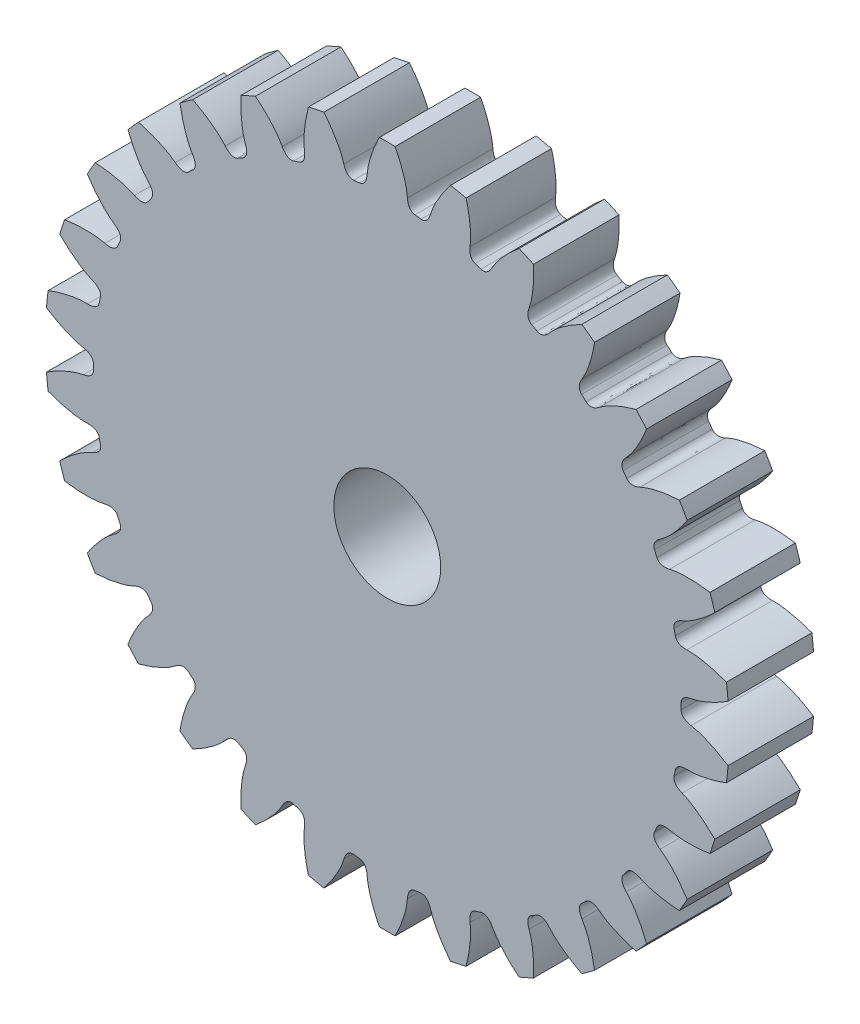
from build123d import *

# Parameters (mm, degrees)
EXTRUDE1_DEPTH = 2
SKETCH2_R      = 1.25
EXTRUDE2_DEPTH = 12.470571478


with BuildPart() as part:
    # Sketch1 → Extrude1 (new body)
    with BuildSketch(Plane.XY):
        with BuildLine():
            ThreePointArc((0.184333675, 7.997876037), (0, 8), (-0.184333675, 7.997876037))
            add(Edge.make_bspline(
                [(-0.47198569, 7.099591561), (-0.469286067, 7.132839678), (-0.46549125, 7.165924865), (-0.46060124, 7.198847123), (-0.455643545, 7.232225066), (-0.449300773, 7.265450529), (-0.442350993, 7.298478539), (-0.435306846, 7.331955018), (-0.427228012, 7.365252221), (-0.418548396, 7.398345624), (-0.409752672, 7.431881716), (-0.400093212, 7.465222127), (-0.389864743, 7.498351216), (-0.379501337, 7.531917354), (-0.368379305, 7.565275496), (-0.356719606, 7.598414883), (-0.344908139, 7.631985628), (-0.332410671, 7.665338129), (-0.319403191, 7.6984647), (-0.306228606, 7.732016843), (-0.292421957, 7.765341701), (-0.278129297, 7.798433697), (-0.263655372, 7.831945381), (-0.248591477, 7.865221509), (-0.23306249, 7.898258048), (-0.217339039, 7.931708293), (-0.201096101, 7.964914289), (-0.184333675, 7.997876037)],
                knots=[0, 0, 0, 0, 1, 1, 1, 2, 2, 2, 3, 3, 3, 4, 4, 4, 5, 5, 5, 6, 6, 6, 7, 7, 7, 8, 8, 8, 9, 9, 9, 9], degree=3))
            add(Edge.make_bspline(
                [(-0.47198569, 7.099591561), (-0.473367286, 7.067212803), (-0.478402983, 7.035771632), (-0.48709278, 7.005268048), (-0.491931339, 6.988283371), (-0.497471268, 6.971169378), (-0.505007172, 6.955186075), (-0.510346356, 6.943861915), (-0.516353477, 6.932649979), (-0.523380636, 6.922283829), (-0.529088677, 6.913863581), (-0.535381628, 6.905681267), (-0.542291515, 6.898213235), (-0.548369306, 6.891644512), (-0.554949881, 6.885395857), (-0.561932005, 6.879796367), (-0.568375211, 6.874629076), (-0.575244381, 6.869843725), (-0.582373694, 6.8656727), (-0.589156218, 6.861704564), (-0.596291163, 6.858168784), (-0.603577698, 6.855226008), (-0.610655373, 6.852367584), (-0.618012907, 6.849984293), (-0.625429277, 6.848177652), (-0.632746719, 6.846395109), (-0.64019316, 6.845140993), (-0.6477686, 6.844415303)],
                knots=[0, 0, 0, 0, 1, 1, 1, 2, 2, 2, 3, 3, 3, 4, 4, 4, 5, 5, 5, 6, 6, 6, 7, 7, 7, 8, 8, 8, 9, 9, 9, 9], degree=3))
            ThreePointArc((-0.6477686, 6.844415303), (-0.718633185, 6.837338031), (-0.789420656, 6.829527072))
            add(Edge.make_bspline(
                [(-1.014416415, 7.042579794), (-1.006333088, 7.01119584), (-0.994870447, 6.981488715), (-0.98002849, 6.953458417), (-0.971764352, 6.937850889), (-0.962787285, 6.922262694), (-0.952092943, 6.908195467), (-0.944516008, 6.898228845), (-0.936309064, 6.888510869), (-0.927280222, 6.879832271), (-0.919946247, 6.872782795), (-0.912089614, 6.866087662), (-0.903778033, 6.860219471), (-0.896467342, 6.855057934), (-0.8887314, 6.850314006), (-0.880737652, 6.846288543), (-0.873360906, 6.842573788), (-0.865646913, 6.839321189), (-0.857806188, 6.836723578), (-0.850346857, 6.834252322), (-0.842632697, 6.832277245), (-0.834893553, 6.830913732), (-0.827376242, 6.829589302), (-0.819683974, 6.82878781), (-0.812054048, 6.828562598), (-0.804525898, 6.82834039), (-0.796981434, 6.828661882), (-0.789420656, 6.829527072)],
                knots=[0, 0, 0, 0, 1, 1, 1, 2, 2, 2, 3, 3, 3, 4, 4, 4, 5, 5, 5, 6, 6, 6, 7, 7, 7, 8, 8, 8, 9, 9, 9, 9], degree=3))
            add(Edge.make_bspline(
                [(-1.014416415, 7.042579794), (-1.023969717, 7.074540077), (-1.034560405, 7.106113287), (-1.04618848, 7.137299424), (-1.057977501, 7.168917216), (-1.071089631, 7.200097887), (-1.084754451, 7.230959214), (-1.098604818, 7.262239592), (-1.113429987, 7.293129487), (-1.128800439, 7.323695127), (-1.144376501, 7.35466964), (-1.160756739, 7.385273169), (-1.177649617, 7.41555169), (-1.19476535, 7.446229654), (-1.212579887, 7.476546439), (-1.23087486, 7.506537464), (-1.249407968, 7.536918865), (-1.268566711, 7.566944164), (-1.288177347, 7.596642433), (-1.308039919, 7.626722231), (-1.328473488, 7.656448297), (-1.349334031, 7.685845543), (-1.370459137, 7.715615617), (-1.392112346, 7.745032623), (-1.41417067, 7.774118576), (-1.436505222, 7.803568764), (-1.459297129, 7.832672032), (-1.482546388, 7.861428382)],
                knots=[0, 0, 0, 0, 1, 1, 1, 2, 2, 2, 3, 3, 3, 4, 4, 4, 5, 5, 5, 6, 6, 6, 7, 7, 7, 8, 8, 8, 9, 9, 9, 9], degree=3))
            ThreePointArc((-1.482546388, 7.861428382), (-1.663293527, 7.825180806), (-1.843157471, 7.78477813))
            add(Edge.make_bspline(
                [(-1.937759756, 6.846317109), (-1.942031798, 6.879399957), (-1.945198705, 6.912551141), (-1.947260475, 6.945770659), (-1.949350783, 6.979449976), (-1.950054577, 7.01326812), (-1.950123576, 7.047019329), (-1.950193512, 7.081228827), (-1.949214098, 7.115478091), (-1.947604657, 7.149652917), (-1.945973686, 7.184284899), (-1.943457171, 7.218905057), (-1.940340143, 7.253436814), (-1.937181994, 7.288424124), (-1.933238553, 7.323365711), (-1.928723712, 7.358205111), (-1.924150104, 7.393497997), (-1.918860111, 7.428720035), (-1.913024278, 7.463827118), (-1.907113472, 7.499385216), (-1.900537158, 7.534852411), (-1.89343704, 7.570192878), (-1.886246876, 7.605981549), (-1.878430659, 7.641662474), (-1.870109701, 7.677205744), (-1.861684542, 7.71319411), (-1.852700466, 7.749051572), (-1.843157471, 7.78477813)],
                knots=[0, 0, 0, 0, 1, 1, 1, 2, 2, 2, 3, 3, 3, 4, 4, 4, 5, 5, 5, 6, 6, 6, 7, 7, 7, 8, 8, 8, 9, 9, 9, 9], degree=3))
            add(Edge.make_bspline(
                [(-1.937759756, 6.846317109), (-1.932379239, 6.814358655), (-1.930767906, 6.782557569), (-1.932925759, 6.75091385), (-1.934127271, 6.733294336), (-1.935987939, 6.715402509), (-1.940036051, 6.698201677), (-1.942904135, 6.686014898), (-1.946448894, 6.673799019), (-1.951167248, 6.662198366), (-1.954999887, 6.652775352), (-1.959454123, 6.643463463), (-1.964660322, 6.634721979), (-1.969239584, 6.627033155), (-1.97437719, 6.61955287), (-1.980042538, 6.612624077), (-1.985270604, 6.606230086), (-1.990994736, 6.600121125), (-1.997101051, 6.594558979), (-2.002910339, 6.589267391), (-2.009154239, 6.584325437), (-2.015669708, 6.579932013), (-2.021998418, 6.57566452), (-2.028699659, 6.571803593), (-2.035578342, 6.568494481), (-2.042365269, 6.56522951), (-2.049388242, 6.562454597), (-2.056647261, 6.560169742)],
                knots=[0, 0, 0, 0, 1, 1, 1, 2, 2, 2, 3, 3, 3, 4, 4, 4, 5, 5, 5, 6, 6, 6, 7, 7, 7, 8, 8, 8, 9, 9, 9, 9], degree=3))
            ThreePointArc((-2.056647261, 6.560169742), (-2.124491836, 6.53851355), (-2.192108442, 6.516155736))
            add(Edge.make_bspline(
                [(-2.456483655, 6.677773497), (-2.442051877, 6.648755976), (-2.424663263, 6.622081239), (-2.404317813, 6.597749287), (-2.392989279, 6.584201032), (-2.380967414, 6.570819914), (-2.367582028, 6.559283568), (-2.35809849, 6.551110074), (-2.348050406, 6.543310778), (-2.337414484, 6.536699031), (-2.328775106, 6.531328421), (-2.319698162, 6.526413079), (-2.310348144, 6.522401197), (-2.302124065, 6.51887243), (-2.293570854, 6.515840561), (-2.284914848, 6.513565058), (-2.276926961, 6.511465191), (-2.268705284, 6.509887498), (-2.260495824, 6.50897683), (-2.252685693, 6.508110458), (-2.244729465, 6.507782406), (-2.23687595, 6.508057748), (-2.229247546, 6.508325197), (-2.221556732, 6.509140531), (-2.214046714, 6.510506592), (-2.206636873, 6.51185443), (-2.199324115, 6.513737478), (-2.192108442, 6.516155736)],
                knots=[0, 0, 0, 0, 1, 1, 1, 2, 2, 2, 3, 3, 3, 4, 4, 4, 5, 5, 5, 6, 6, 6, 7, 7, 7, 8, 8, 8, 9, 9, 9, 9], degree=3))
            add(Edge.make_bspline(
                [(-2.456483655, 6.677773497), (-2.472473111, 6.707049127), (-2.489396807, 6.735730459), (-2.507254743, 6.763817492), (-2.525359854, 6.792293284), (-2.544668278, 6.820066417), (-2.56445092, 6.847412275), (-2.58450218, 6.875129448), (-2.605425754, 6.902261999), (-2.626815278, 6.928964009), (-2.648490929, 6.95602321), (-2.670876051, 6.982552335), (-2.693695037, 7.00865697), (-2.716815058, 7.035105986), (-2.740543519, 7.061056427), (-2.764674187, 7.086588337), (-2.789118951, 7.112452582), (-2.81410164, 7.137838429), (-2.839458354, 7.162810439), (-2.865140823, 7.188103261), (-2.891308266, 7.212931363), (-2.917824987, 7.237349057), (-2.944678006, 7.262076428), (-2.971974179, 7.286348646), (-2.999597786, 7.310212818), (-3.027567313, 7.334375834), (-3.055912071, 7.358104422), (-3.08463206, 7.381398584)],
                knots=[0, 0, 0, 0, 1, 1, 1, 2, 2, 2, 3, 3, 3, 4, 4, 4, 5, 5, 5, 6, 6, 6, 7, 7, 7, 8, 8, 8, 9, 9, 9, 9], degree=3))
            ThreePointArc((-3.08463206, 7.381398584), (-3.253893145, 7.308363661), (-3.421426442, 7.231448064))
            add(Edge.make_bspline(
                [(-3.318844422, 6.293825746), (-3.329901421, 6.325297448), (-3.339891642, 6.357065762), (-3.348815083, 6.389130688), (-3.357862036, 6.421639431), (-3.365581639, 6.45457224), (-3.372666401, 6.487571559), (-3.379847363, 6.521018957), (-3.386010174, 6.554723424), (-3.391541249, 6.58848607), (-3.397146313, 6.622700357), (-3.401882725, 6.657087195), (-3.406013368, 6.691512417), (-3.410198503, 6.726391786), (-3.413605999, 6.761389703), (-3.416433338, 6.796406467), (-3.419297478, 6.831879025), (-3.421446157, 6.867431229), (-3.423037023, 6.902984475), (-3.424648327, 6.93899447), (-3.425589766, 6.975053913), (-3.425992499, 7.011098304), (-3.42640034, 7.047599826), (-3.426173408, 7.08412612), (-3.425424144, 7.120622709), (-3.424665497, 7.157576331), (-3.42333293, 7.194518116), (-3.421426442, 7.231448064)],
                knots=[0, 0, 0, 0, 1, 1, 1, 2, 2, 2, 3, 3, 3, 4, 4, 4, 5, 5, 5, 6, 6, 6, 7, 7, 7, 8, 8, 8, 9, 9, 9, 9], degree=3))
            add(Edge.make_bspline(
                [(-3.318844422, 6.293825746), (-3.306936946, 6.263684334), (-3.298749007, 6.232913193), (-3.294280607, 6.201512323), (-3.29179256, 6.184028029), (-3.289892648, 6.166140327), (-3.290276044, 6.148473724), (-3.29054768, 6.135956947), (-3.291475154, 6.123271018), (-3.293678489, 6.110942865), (-3.295468221, 6.100928917), (-3.297889071, 6.090894427), (-3.301164045, 6.081261536), (-3.304044643, 6.072788649), (-3.307514741, 6.064403658), (-3.31161571, 6.056448383), (-3.315400145, 6.04910714), (-3.319729067, 6.041941561), (-3.324545509, 6.035231387), (-3.329127667, 6.028847614), (-3.334207633, 6.022715474), (-3.339667279, 6.017063414), (-3.34497043, 6.011573364), (-3.350722501, 6.006403541), (-3.356762865, 6.001736582), (-3.362722655, 5.997131877), (-3.369015223, 5.992957444), (-3.375640567, 5.989213284)],
                knots=[0, 0, 0, 0, 1, 1, 1, 2, 2, 2, 3, 3, 3, 4, 4, 4, 5, 5, 5, 6, 6, 6, 7, 7, 7, 8, 8, 8, 9, 9, 9, 9], degree=3))
            ThreePointArc((-3.375640567, 5.989213284), (-3.4375, 5.953924651), (-3.49899057, 5.917997127))
            add(Edge.make_bspline(
                [(-3.791190772, 6.021116454), (-3.771041282, 5.99573357), (-3.748486661, 5.973257037), (-3.72352691, 5.953686854), (-3.709629091, 5.942789995), (-3.695087842, 5.932200772), (-3.679596417, 5.923699502), (-3.668620752, 5.917676357), (-3.657170679, 5.912136608), (-3.645392518, 5.907880676), (-3.635825318, 5.904423655), (-3.62592477, 5.901502928), (-3.615944955, 5.899522693), (-3.60716692, 5.89778092), (-3.598170256, 5.896593618), (-3.589230301, 5.896167524), (-3.580980381, 5.895774319), (-3.572610347, 5.895940486), (-3.564390945, 5.89675656), (-3.556571356, 5.897532939), (-3.548720784, 5.898866248), (-3.541096133, 5.90076841), (-3.533690034, 5.902616049), (-3.526336801, 5.905012577), (-3.519274915, 5.907910206), (-3.512307228, 5.910769184), (-3.505545779, 5.914131491), (-3.49899057, 5.917997127)],
                knots=[0, 0, 0, 0, 1, 1, 1, 2, 2, 2, 3, 3, 3, 4, 4, 4, 5, 5, 5, 6, 6, 6, 7, 7, 7, 8, 8, 8, 9, 9, 9, 9], degree=3))
            add(Edge.make_bspline(
                [(-3.791190772, 6.021116454), (-3.812917566, 6.046427947), (-3.835434622, 6.070963888), (-3.858741942, 6.094724279), (-3.882371863, 6.118813542), (-3.907032711, 6.141965318), (-3.932068578, 6.164600561), (-3.957444394, 6.187543156), (-3.983551913, 6.20973254), (-4.010025684, 6.231403915), (-4.036853594, 6.253365186), (-4.064265263, 6.274660458), (-4.092013059, 6.29545031), (-4.120126911, 6.316514429), (-4.148732248, 6.336964366), (-4.177643986, 6.356921294), (-4.206932052, 6.377137991), (-4.236646824, 6.396774904), (-4.266641406, 6.415929258), (-4.297021324, 6.435329685), (-4.327778999, 6.454174717), (-4.35879299, 6.47254569), (-4.390200315, 6.491149651), (-4.42194648, 6.509216269), (-4.453928084, 6.526815682), (-4.486310184, 6.544635486), (-4.518968992, 6.561952341), (-4.551904509, 6.578766248)],
                knots=[0, 0, 0, 0, 1, 1, 1, 2, 2, 2, 3, 3, 3, 4, 4, 4, 5, 5, 5, 6, 6, 6, 7, 7, 7, 8, 8, 8, 9, 9, 9, 9], degree=3))
            ThreePointArc((-4.551904509, 6.578766248), (-4.702282018, 6.472135955), (-4.850162659, 6.362069017))
            add(Edge.make_bspline(
                [(-4.554879661, 5.466263998), (-4.572238373, 5.494749088), (-4.588615287, 5.523746104), (-4.604010403, 5.553255047), (-4.619618607, 5.583172429), (-4.634016633, 5.613780582), (-4.64780752, 5.644585781), (-4.661785666, 5.675809268), (-4.674821358, 5.70749589), (-4.687251214, 5.739370766), (-4.699847345, 5.771672031), (-4.71162968, 5.804322678), (-4.722827464, 5.837136817), (-4.734172973, 5.870383851), (-4.744782484, 5.903908521), (-4.754828432, 5.937572247), (-4.765005143, 5.971674157), (-4.774498588, 6.006002724), (-4.783446625, 6.040448287), (-4.792509617, 6.075336368), (-4.800927664, 6.11041209), (-4.808815646, 6.145585091), (-4.816803668, 6.181204173), (-4.824175938, 6.216979462), (-4.831031115, 6.252834293), (-4.837972137, 6.289138121), (-4.844349318, 6.325549696), (-4.850162659, 6.362069017)],
                knots=[0, 0, 0, 0, 1, 1, 1, 2, 2, 2, 3, 3, 3, 4, 4, 4, 5, 5, 5, 6, 6, 6, 7, 7, 7, 8, 8, 8, 9, 9, 9, 9], degree=3))
            add(Edge.make_bspline(
                [(-4.554879661, 5.466263998), (-4.53696564, 5.439256951), (-4.522558947, 5.410860601), (-4.511659584, 5.381074949), (-4.505590718, 5.364490022), (-4.500013262, 5.347388223), (-4.496715186, 5.330027966), (-4.494378502, 5.317728234), (-4.492648155, 5.30512669), (-4.492240175, 5.292609838), (-4.49190878, 5.282442612), (-4.492190441, 5.272124077), (-4.493391059, 5.262020783), (-4.494447096, 5.253134138), (-4.496098026, 5.244210905), (-4.498455385, 5.235576833), (-4.500630791, 5.227609186), (-4.503375307, 5.219700158), (-4.506691375, 5.212135223), (-4.509846141, 5.204938266), (-4.513540154, 5.197883944), (-4.517705364, 5.191220271), (-4.521751183, 5.184747604), (-4.526302691, 5.178494832), (-4.531240743, 5.172673995), (-4.536112926, 5.166930804), (-4.541400072, 5.161539294), (-4.547102182, 5.156499467)],
                knots=[0, 0, 0, 0, 1, 1, 1, 2, 2, 2, 3, 3, 3, 4, 4, 4, 5, 5, 5, 6, 6, 6, 7, 7, 7, 8, 8, 8, 9, 9, 9, 9], degree=3))
            ThreePointArc((-4.547102182, 5.156499467), (-4.600272919, 5.109120675), (-4.65295002, 5.061193645))
            add(Edge.make_bspline(
                [(-4.96020466, 5.10130773), (-4.935218086, 5.080668838), (-4.908483204, 5.06337284), (-4.880000014, 5.049419736), (-4.864140311, 5.041650519), (-4.8477152, 5.034315992), (-4.830794786, 5.029221343), (-4.818806684, 5.025611787), (-4.806455044, 5.022573699), (-4.794049405, 5.020859587), (-4.783972517, 5.019467243), (-4.773681067, 5.01866878), (-4.76350762, 5.018806738), (-4.754559272, 5.018928083), (-4.745512352, 5.019637238), (-4.736679167, 5.021079177), (-4.728527775, 5.022409819), (-4.720375194, 5.024312583), (-4.712505077, 5.026819734), (-4.705017783, 5.02920493), (-4.697615976, 5.032141329), (-4.690553424, 5.035587179), (-4.683693312, 5.038934257), (-4.676999031, 5.042807238), (-4.670693914, 5.047109796), (-4.664472903, 5.051354961), (-4.658558271, 5.056049578), (-4.65295002, 5.061193645)],
                knots=[0, 0, 0, 0, 1, 1, 1, 2, 2, 2, 3, 3, 3, 4, 4, 4, 5, 5, 5, 6, 6, 6, 7, 7, 7, 8, 8, 8, 9, 9, 9, 9], degree=3))
            add(Edge.make_bspline(
                [(-4.96020466, 5.10130773), (-4.986719227, 5.121548851), (-5.013845541, 5.140867064), (-5.041583602, 5.159262369), (-5.069705592, 5.177912287), (-5.098641067, 5.195430862), (-5.127835972, 5.212366222), (-5.157427299, 5.229531537), (-5.187577738, 5.245807972), (-5.217978726, 5.261501568), (-5.248786387, 5.277405097), (-5.280026581, 5.292535809), (-5.311490474, 5.307102263), (-5.343369448, 5.321860881), (-5.37560147, 5.335916554), (-5.408030696, 5.349426287), (-5.440882036, 5.363111869), (-5.474030212, 5.37614162), (-5.507351755, 5.388641181), (-5.541101374, 5.401301323), (-5.575105022, 5.413339665), (-5.609260824, 5.424861016), (-5.643849805, 5.436528487), (-5.6786585, 5.447599907), (-5.713600354, 5.458165381), (-5.748979772, 5.468863162), (-5.784525283, 5.479011455), (-5.820236888, 5.488610258)],
                knots=[0, 0, 0, 0, 1, 1, 1, 2, 2, 2, 3, 3, 3, 4, 4, 4, 5, 5, 5, 6, 6, 6, 7, 7, 7, 8, 8, 8, 9, 9, 9, 9], degree=3))
            ThreePointArc((-5.820236888, 5.488610258), (-5.945158604, 5.353044851), (-6.066923495, 5.214637026))
            add(Edge.make_bspline(
                [(-5.591844803, 4.399800283), (-5.614746568, 4.424053826), (-5.636794426, 4.449012236), (-5.657988376, 4.474675513), (-5.679475676, 4.500694001), (-5.699922864, 4.527639774), (-5.719817148, 4.554904519), (-5.739981566, 4.582539477), (-5.759320416, 4.610823398), (-5.77810581, 4.639417419), (-5.797142495, 4.668393941), (-5.815455809, 4.697881408), (-5.833231338, 4.72765033), (-5.851241367, 4.757811971), (-5.868589205, 4.788398206), (-5.885414708, 4.819237629), (-5.902459219, 4.850478472), (-5.91888252, 4.88208308), (-5.934796657, 4.913915524), (-5.95091524, 4.946156914), (-5.966441985, 4.978715937), (-5.981470474, 5.01148032), (-5.996689562, 5.044660237), (-6.011338831, 5.078120968), (-6.025498844, 5.111767014), (-6.039836178, 5.145834397), (-6.053644395, 5.180124401), (-6.066923495, 5.214637026)],
                knots=[0, 0, 0, 0, 1, 1, 1, 2, 2, 2, 3, 3, 3, 4, 4, 4, 5, 5, 5, 6, 6, 6, 7, 7, 7, 8, 8, 8, 9, 9, 9, 9], degree=3))
            add(Edge.make_bspline(
                [(-5.591844803, 4.399800283), (-5.568707165, 4.377107939), (-5.54871136, 4.352327437), (-5.531857388, 4.325458778), (-5.522472942, 4.31049806), (-5.513461702, 4.294929595), (-5.506626297, 4.278634409), (-5.501783417, 4.26708928), (-5.497470874, 4.25512287), (-5.49446941, 4.242964364), (-5.492031371, 4.233088218), (-5.490161533, 4.222936607), (-5.489235321, 4.212804471), (-5.488420645, 4.203892459), (-5.488180253, 4.194820972), (-5.488690974, 4.185885453), (-5.489162275, 4.177639625), (-5.490202438, 4.169332812), (-5.491873203, 4.16124374), (-5.493462698, 4.153548141), (-5.495609312, 4.145879944), (-5.498298047, 4.138495892), (-5.500909712, 4.131323496), (-5.504061733, 4.12426105), (-5.507681657, 4.117540733), (-5.511253295, 4.110910061), (-5.515303946, 4.104537109), (-5.519833612, 4.098421878)],
                knots=[0, 0, 0, 0, 1, 1, 1, 2, 2, 2, 3, 3, 3, 4, 4, 4, 5, 5, 5, 6, 6, 6, 7, 7, 7, 8, 8, 8, 9, 9, 9, 9], degree=3))
            ThreePointArc((-5.519833612, 4.098421878), (-5.561991836, 4.04102361), (-5.603553226, 3.983191715))
            add(Edge.make_bspline(
                [(-5.912433803, 3.958547379), (-5.883702179, 3.943554497), (-5.853955478, 3.932194953), (-5.8231937, 3.924468746), (-5.806065258, 3.920166722), (-5.788474142, 3.916407445), (-5.770864243, 3.914942078), (-5.758387641, 3.913903866), (-5.745674259, 3.913500218), (-5.73318333, 3.914402841), (-5.723037161, 3.915136025), (-5.712804594, 3.916494724), (-5.702882144, 3.918744846), (-5.694154568, 3.920724006), (-5.685452787, 3.923298624), (-5.677112424, 3.926545575), (-5.669415816, 3.92954191), (-5.661836995, 3.93309811), (-5.654660125, 3.937186763), (-5.647832357, 3.941076533), (-5.641202808, 3.945487687), (-5.635011023, 3.950326624), (-5.628996717, 3.955026858), (-5.62325396, 3.960207024), (-5.617981177, 3.965726468), (-5.612778729, 3.971172288), (-5.607969412, 3.976994037), (-5.603553226, 3.983191715)],
                knots=[0, 0, 0, 0, 1, 1, 1, 2, 2, 2, 3, 3, 3, 4, 4, 4, 5, 5, 5, 6, 6, 6, 7, 7, 7, 8, 8, 8, 9, 9, 9, 9], degree=3))
            add(Edge.make_bspline(
                [(-5.912433803, 3.958547379), (-5.942577328, 3.972833495), (-5.97312735, 3.986089681), (-6.004083867, 3.998315936), (-6.03546886, 4.010711418), (-6.067414342, 4.021831148), (-6.099492327, 4.032326467), (-6.132005882, 4.042964296), (-6.164881523, 4.052616423), (-6.197881059, 4.061646355), (-6.231322028, 4.070797081), (-6.265025401, 4.079101949), (-6.298830268, 4.08680838), (-6.333081099, 4.094616476), (-6.367531114, 4.101663584), (-6.402060514, 4.108135682), (-6.437039366, 4.114692024), (-6.472172213, 4.12054515), (-6.507364404, 4.125843627), (-6.543008705, 4.131210174), (-6.578772204, 4.135915694), (-6.614577043, 4.140083885), (-6.650835975, 4.14430494), (-6.687185895, 4.147897288), (-6.723560871, 4.150967061), (-6.760391358, 4.154075276), (-6.797270063, 4.156611477), (-6.834196987, 4.158575663)],
                knots=[0, 0, 0, 0, 1, 1, 1, 2, 2, 2, 3, 3, 3, 4, 4, 4, 5, 5, 5, 6, 6, 6, 7, 7, 7, 8, 8, 8, 9, 9, 9, 9], degree=3))
            ThreePointArc((-6.834196987, 4.158575663), (-6.92820323, 4), (-7.018530661, 3.839300373))
            add(Edge.make_bspline(
                [(-6.384419493, 3.141044182), (-6.411863396, 3.160006183), (-6.4386186, 3.179835184), (-6.464685107, 3.200531187), (-6.491112406, 3.221513648), (-6.516715115, 3.243619381), (-6.54184332, 3.266152072), (-6.567312728, 3.288990722), (-6.592109535, 3.312635799), (-6.616429454, 3.336699269), (-6.6410747, 3.361084635), (-6.665118613, 3.386120178), (-6.688695011, 3.411542837), (-6.712582436, 3.437300879), (-6.735910418, 3.463611912), (-6.75878012, 3.490279201), (-6.781947504, 3.517293604), (-6.804582884, 3.544792979), (-6.826767596, 3.572621072), (-6.849237312, 3.600806669), (-6.871194161, 3.629426008), (-6.89270634, 3.658349812), (-6.914491347, 3.687640441), (-6.935777372, 3.717324221), (-6.956623361, 3.747290987), (-6.977730397, 3.777633017), (-6.998366164, 3.808302813), (-7.018530661, 3.839300373)],
                knots=[0, 0, 0, 0, 1, 1, 1, 2, 2, 2, 3, 3, 3, 4, 4, 4, 5, 5, 5, 6, 6, 6, 7, 7, 7, 8, 8, 8, 9, 9, 9, 9], degree=3))
            add(Edge.make_bspline(
                [(-6.384419493, 3.141044182), (-6.357069465, 3.123658307), (-6.33235846, 3.10357668), (-6.31028648, 3.080799303), (-6.297996598, 3.068116649), (-6.28594541, 3.054761934), (-6.275871415, 3.040243997), (-6.268733996, 3.029958048), (-6.262027736, 3.019149761), (-6.256563966, 3.007880988), (-6.252125838, 2.998727555), (-6.248186222, 2.989186543), (-6.24517366, 2.979468389), (-6.242523874, 2.970920506), (-6.240402668, 2.962097233), (-6.239044429, 2.953250792), (-6.237791027, 2.945087166), (-6.237081376, 2.936745615), (-6.237033819, 2.928485936), (-6.236988575, 2.92062803), (-6.237493972, 2.912681096), (-6.238588721, 2.904899384), (-6.23965209, 2.897340726), (-6.241266867, 2.889777269), (-6.243410455, 2.882451184), (-6.245525449, 2.875222822), (-6.248162573, 2.868146956), (-6.251321827, 2.861223588)],
                knots=[0, 0, 0, 0, 1, 1, 1, 2, 2, 2, 3, 3, 3, 4, 4, 4, 5, 5, 5, 6, 6, 6, 7, 7, 7, 8, 8, 8, 9, 9, 9, 9], degree=3))
            ThreePointArc((-6.251321827, 2.861223588), (-6.280625021, 2.796314421), (-6.309254268, 2.731105194))
            add(Edge.make_bspline(
                [(-6.606261218, 2.642779512), (-6.575040253, 2.634087901), (-6.543581806, 2.629161277), (-6.511885879, 2.62799964), (-6.494237294, 2.627352829), (-6.476248988, 2.6273331), (-6.45871924, 2.629561058), (-6.446299425, 2.631139565), (-6.433779938, 2.633387999), (-6.421749632, 2.636867907), (-6.411977618, 2.639694577), (-6.402251147, 2.643151055), (-6.393013354, 2.647415), (-6.384887986, 2.651165475), (-6.376911653, 2.655493034), (-6.369428626, 2.660403091), (-6.362523181, 2.664934163), (-6.355849351, 2.669988377), (-6.349679391, 2.675479838), (-6.343809555, 2.680704181), (-6.338242009, 2.686397301), (-6.3331916, 2.69241784), (-6.328285954, 2.698265807), (-6.323745707, 2.70452676), (-6.319735705, 2.711021865), (-6.315779193, 2.71743033), (-6.31228538, 2.724124773), (-6.309254268, 2.731105194)],
                knots=[0, 0, 0, 0, 1, 1, 1, 2, 2, 2, 3, 3, 3, 4, 4, 4, 5, 5, 5, 6, 6, 6, 7, 7, 7, 8, 8, 8, 9, 9, 9, 9], degree=3))
            add(Edge.make_bspline(
                [(-6.606261218, 2.642779512), (-6.638716285, 2.650486251), (-6.671354831, 2.657101051), (-6.704176856, 2.662623912), (-6.737453177, 2.668223215), (-6.771012495, 2.672458113), (-6.804571599, 2.676054696), (-6.838586384, 2.679700115), (-6.872750403, 2.682306089), (-6.906906249, 2.684277707), (-6.941518995, 2.686275699), (-6.976212548, 2.687391761), (-7.010880955, 2.68790136), (-7.046006717, 2.688417682), (-7.081169092, 2.688148233), (-7.116289568, 2.687299835), (-7.151867187, 2.686440393), (-7.187449231, 2.684861084), (-7.222974004, 2.682726909), (-7.258955159, 2.680565317), (-7.294915472, 2.67773236), (-7.330804505, 2.674365222), (-7.367148699, 2.670955381), (-7.403451177, 2.666911655), (-7.439669514, 2.662351563), (-7.476341401, 2.657734367), (-7.512941524, 2.652547631), (-7.549469883, 2.646791357)],
                knots=[0, 0, 0, 0, 1, 1, 1, 2, 2, 2, 3, 3, 3, 4, 4, 4, 5, 5, 5, 6, 6, 6, 7, 7, 7, 8, 8, 8, 9, 9, 9, 9], degree=3))
            ThreePointArc((-7.549469883, 2.646791357), (-7.60845213, 2.472135955), (-7.663394359, 2.296167872))
            add(Edge.make_bspline(
                [(-6.897964416, 1.745009379), (-6.928751025, 1.757851106), (-6.959044245, 1.771684077), (-6.988844077, 1.786508291), (-7.019056375, 1.80153769), (-7.048695644, 1.817837257), (-7.077959548, 1.834653107), (-7.10762081, 1.85169729), (-7.136791835, 1.869670119), (-7.165583383, 1.888151349), (-7.194760073, 1.906879802), (-7.223483752, 1.926369247), (-7.251830617, 1.946334551), (-7.280551442, 1.966563243), (-7.308840023, 1.987449157), (-7.336754408, 2.008778824), (-7.36503214, 2.030386127), (-7.392890323, 2.052578415), (-7.420376032, 2.075185936), (-7.448214846, 2.098083894), (-7.47564218, 2.121512745), (-7.502697864, 2.145331861), (-7.53009668, 2.169453063), (-7.557089159, 2.194062567), (-7.583710055, 2.219040363), (-7.610664314, 2.244330947), (-7.637225749, 2.270040117), (-7.663394359, 2.296167872)],
                knots=[0, 0, 0, 0, 1, 1, 1, 2, 2, 2, 3, 3, 3, 4, 4, 4, 5, 5, 5, 6, 6, 6, 7, 7, 7, 8, 8, 8, 9, 9, 9, 9], degree=3))
            add(Edge.make_bspline(
                [(-6.897964416, 1.745009379), (-6.867597325, 1.733689817), (-6.83925111, 1.719184729), (-6.812925773, 1.701494115), (-6.798267582, 1.691643817), (-6.783703139, 1.681086518), (-6.770830837, 1.668980334), (-6.761710819, 1.660403111), (-6.752903938, 1.65122532), (-6.745216654, 1.641338779), (-6.738972404, 1.633308109), (-6.73313519, 1.624794683), (-6.728167942, 1.615915241), (-6.723798856, 1.608105071), (-6.719889542, 1.599915632), (-6.716721705, 1.5915449), (-6.713798379, 1.583820266), (-6.71136993, 1.575808542), (-6.709606128, 1.567739246), (-6.707928122, 1.56006246), (-6.706770215, 1.552184108), (-6.706223132, 1.544344834), (-6.70569173, 1.536730263), (-6.70569869, 1.528996355), (-6.706272256, 1.521384685), (-6.706838171, 1.513874548), (-6.707946513, 1.506405019), (-6.70959728, 1.498976097)],
                knots=[0, 0, 0, 0, 1, 1, 1, 2, 2, 2, 3, 3, 3, 4, 4, 4, 5, 5, 5, 6, 6, 6, 7, 7, 7, 8, 8, 8, 9, 9, 9, 9], degree=3))
            ThreePointArc((-6.70959728, 1.498976097), (-6.724764755, 1.429392874), (-6.739210624, 1.35965627))
            add(Edge.make_bspline(
                [(-7.011363317, 1.211509499), (-6.979017517, 1.209499025), (-6.947222211, 1.211220638), (-6.915977397, 1.216674339), (-6.898579997, 1.21971101), (-6.880980676, 1.22343169), (-6.864297214, 1.229255602), (-6.852476992, 1.23338184), (-6.840698562, 1.238184088), (-6.82965466, 1.244089193), (-6.820683886, 1.248885809), (-6.811888604, 1.254289002), (-6.803739202, 1.260380414), (-6.796571161, 1.265738292), (-6.78966888, 1.271629656), (-6.783370234, 1.277988225), (-6.777557751, 1.283856005), (-6.772080591, 1.29018734), (-6.767187199, 1.296841606), (-6.762531834, 1.303172192), (-6.758269619, 1.309898462), (-6.754581313, 1.316837476), (-6.750998729, 1.323577592), (-6.747859423, 1.330645699), (-6.745287457, 1.337832596), (-6.742749798, 1.344923626), (-6.740724187, 1.352198184), (-6.739210624, 1.35965627)],
                knots=[0, 0, 0, 0, 1, 1, 1, 2, 2, 2, 3, 3, 3, 4, 4, 4, 5, 5, 5, 6, 6, 6, 7, 7, 7, 8, 8, 8, 9, 9, 9, 9], degree=3))
            add(Edge.make_bspline(
                [(-7.011363317, 1.211509499), (-7.044711484, 1.212300039), (-7.078012094, 1.211984355), (-7.111265146, 1.210562445), (-7.144978461, 1.209120854), (-7.178684912, 1.206285835), (-7.21225844, 1.202826494), (-7.246287846, 1.19932018), (-7.280247111, 1.194766109), (-7.314066492, 1.189593242), (-7.348338273, 1.184351179), (-7.382505731, 1.178229657), (-7.416522501, 1.171520153), (-7.450988031, 1.164722135), (-7.485326002, 1.157147906), (-7.519502619, 1.149016089), (-7.554124094, 1.140778425), (-7.588600228, 1.131835705), (-7.62290498, 1.122362152), (-7.65765044, 1.112766893), (-7.692235929, 1.102519273), (-7.726640633, 1.091763966), (-7.761481674, 1.080872255), (-7.796150118, 1.069369184), (-7.8306289, 1.057378526), (-7.865539449, 1.045237712), (-7.900261389, 1.032554726), (-7.934794719, 1.019329567)],
                knots=[0, 0, 0, 0, 1, 1, 1, 2, 2, 2, 3, 3, 3, 4, 4, 4, 5, 5, 5, 6, 6, 6, 7, 7, 7, 8, 8, 8, 9, 9, 9, 9], degree=3))
            ThreePointArc((-7.934794719, 1.019329567), (-7.956175163, 0.836227706), (-7.973330951, 0.652681816))
            add(Edge.make_bspline(
                [(-7.110035194, 0.272709292), (-7.142818987, 0.278869501), (-7.175326264, 0.286101873), (-7.207557025, 0.294406409), (-7.2402339, 0.30282589), (-7.27261435, 0.312606923), (-7.304734979, 0.322970998), (-7.337291757, 0.333475802), (-7.369562087, 0.344990884), (-7.401566934, 0.357082155), (-7.433999907, 0.369335171), (-7.466147988, 0.382426737), (-7.498026426, 0.396062106), (-7.530325414, 0.409877358), (-7.562338247, 0.424425338), (-7.594077323, 0.439485173), (-7.62622953, 0.454741034), (-7.658092981, 0.470656325), (-7.689678429, 0.487055217), (-7.721669651, 0.503664785), (-7.753368765, 0.520879196), (-7.784785489, 0.538552614), (-7.816600655, 0.556450175), (-7.848119888, 0.574909851), (-7.879352228, 0.593807027), (-7.910975681, 0.612940846), (-7.942301922, 0.632565775), (-7.973330951, 0.652681816)],
                knots=[0, 0, 0, 0, 1, 1, 1, 2, 2, 2, 3, 3, 3, 4, 4, 4, 5, 5, 5, 6, 6, 6, 7, 7, 7, 8, 8, 8, 9, 9, 9, 9], degree=3))
            add(Edge.make_bspline(
                [(-7.110035194, 0.272709292), (-7.077978227, 0.267950763), (-7.047235668, 0.259656155), (-7.017807517, 0.247825469), (-7.001421651, 0.241238034), (-6.98498049, 0.233939554), (-6.969872462, 0.224774222), (-6.959168433, 0.21828059), (-6.948645833, 0.21113441), (-6.939071007, 0.203062189), (-6.931293539, 0.196505261), (-6.923813841, 0.189391499), (-6.917109, 0.181738843), (-6.911211563, 0.175007728), (-6.905684997, 0.16781004), (-6.900846012, 0.160280859), (-6.896380526, 0.153332821), (-6.892339413, 0.146001075), (-6.888936453, 0.138474827), (-6.885699022, 0.131314675), (-6.882928417, 0.123849226), (-6.880763412, 0.116295004), (-6.878660465, 0.108957314), (-6.877059302, 0.101390964), (-6.876037779, 0.093826376), (-6.875029883, 0.086362693), (-6.874561002, 0.078825954), (-6.874631136, 0.071216157)],
                knots=[0, 0, 0, 0, 1, 1, 1, 2, 2, 2, 3, 3, 3, 4, 4, 4, 5, 5, 5, 6, 6, 6, 7, 7, 7, 8, 8, 8, 9, 9, 9, 9], degree=3))
            ThreePointArc((-6.874631136, 0.071216157), (-6.875, 0), (-6.874631136, -0.071216157))
            add(Edge.make_bspline(
                [(-7.110035194, -0.272709292), (-7.077978227, -0.267950763), (-7.047235668, -0.259656155), (-7.017807517, -0.247825469), (-7.001421651, -0.241238034), (-6.98498049, -0.233939554), (-6.969872462, -0.224774222), (-6.959168433, -0.21828059), (-6.948645833, -0.21113441), (-6.939071007, -0.203062189), (-6.931293539, -0.196505261), (-6.923813841, -0.189391499), (-6.917109, -0.181738843), (-6.911211563, -0.175007728), (-6.905684997, -0.16781004), (-6.900846012, -0.160280859), (-6.896380526, -0.153332821), (-6.892339413, -0.146001075), (-6.888936453, -0.138474827), (-6.885699022, -0.131314675), (-6.882928417, -0.123849226), (-6.880763412, -0.116295004), (-6.878660465, -0.108957314), (-6.877059302, -0.101390964), (-6.876037779, -0.093826376), (-6.875029883, -0.086362693), (-6.874561002, -0.078825954), (-6.874631136, -0.071216157)],
                knots=[0, 0, 0, 0, 1, 1, 1, 2, 2, 2, 3, 3, 3, 4, 4, 4, 5, 5, 5, 6, 6, 6, 7, 7, 7, 8, 8, 8, 9, 9, 9, 9], degree=3))
            add(Edge.make_bspline(
                [(-7.110035194, -0.272709292), (-7.142818987, -0.278869501), (-7.175326264, -0.286101873), (-7.207557025, -0.294406409), (-7.2402339, -0.30282589), (-7.27261435, -0.312606923), (-7.304734979, -0.322970998), (-7.337291757, -0.333475802), (-7.369562087, -0.344990884), (-7.401566934, -0.357082155), (-7.433999907, -0.369335171), (-7.466147988, -0.382426737), (-7.498026426, -0.396062106), (-7.530325414, -0.409877358), (-7.562338247, -0.424425338), (-7.594077323, -0.439485173), (-7.62622953, -0.454741034), (-7.658092981, -0.470656325), (-7.689678429, -0.487055217), (-7.721669651, -0.503664785), (-7.753368765, -0.520879196), (-7.784785489, -0.538552614), (-7.816600655, -0.556450175), (-7.848119888, -0.574909851), (-7.879352228, -0.593807027), (-7.910975681, -0.612940846), (-7.942301922, -0.632565775), (-7.973330951, -0.652681816)],
                knots=[0, 0, 0, 0, 1, 1, 1, 2, 2, 2, 3, 3, 3, 4, 4, 4, 5, 5, 5, 6, 6, 6, 7, 7, 7, 8, 8, 8, 9, 9, 9, 9], degree=3))
            ThreePointArc((-7.973330951, -0.652681816), (-7.956175163, -0.836227706), (-7.934794719, -1.019329567))
            add(Edge.make_bspline(
                [(-7.011363317, -1.211509499), (-7.044711484, -1.212300039), (-7.078012094, -1.211984355), (-7.111265146, -1.210562445), (-7.144978461, -1.209120854), (-7.178684912, -1.206285835), (-7.21225844, -1.202826494), (-7.246287846, -1.19932018), (-7.280247111, -1.194766109), (-7.314066492, -1.189593242), (-7.348338273, -1.184351179), (-7.382505731, -1.178229657), (-7.416522501, -1.171520153), (-7.450988031, -1.164722135), (-7.485326002, -1.157147906), (-7.519502619, -1.149016089), (-7.554124094, -1.140778425), (-7.588600228, -1.131835705), (-7.62290498, -1.122362152), (-7.65765044, -1.112766893), (-7.692235929, -1.102519273), (-7.726640633, -1.091763966), (-7.761481674, -1.080872255), (-7.796150118, -1.069369184), (-7.8306289, -1.057378526), (-7.865539449, -1.045237712), (-7.900261389, -1.032554726), (-7.934794719, -1.019329567)],
                knots=[0, 0, 0, 0, 1, 1, 1, 2, 2, 2, 3, 3, 3, 4, 4, 4, 5, 5, 5, 6, 6, 6, 7, 7, 7, 8, 8, 8, 9, 9, 9, 9], degree=3))
            add(Edge.make_bspline(
                [(-7.011363317, -1.211509499), (-6.979017517, -1.209499025), (-6.947222211, -1.211220638), (-6.915977397, -1.216674339), (-6.898579997, -1.21971101), (-6.880980676, -1.22343169), (-6.864297214, -1.229255602), (-6.852476992, -1.23338184), (-6.840698562, -1.238184088), (-6.82965466, -1.244089193), (-6.820683886, -1.248885809), (-6.811888604, -1.254289002), (-6.803739202, -1.260380414), (-6.796571161, -1.265738292), (-6.78966888, -1.271629656), (-6.783370234, -1.277988225), (-6.777557751, -1.283856005), (-6.772080591, -1.29018734), (-6.767187199, -1.296841606), (-6.762531834, -1.303172192), (-6.758269619, -1.309898462), (-6.754581313, -1.316837476), (-6.750998729, -1.323577592), (-6.747859423, -1.330645699), (-6.745287457, -1.337832596), (-6.742749798, -1.344923626), (-6.740724187, -1.352198184), (-6.739210624, -1.35965627)],
                knots=[0, 0, 0, 0, 1, 1, 1, 2, 2, 2, 3, 3, 3, 4, 4, 4, 5, 5, 5, 6, 6, 6, 7, 7, 7, 8, 8, 8, 9, 9, 9, 9], degree=3))
            ThreePointArc((-6.739210624, -1.35965627), (-6.724764755, -1.429392874), (-6.70959728, -1.498976097))
            add(Edge.make_bspline(
                [(-6.897964416, -1.745009379), (-6.867597325, -1.733689817), (-6.83925111, -1.719184729), (-6.812925773, -1.701494115), (-6.798267582, -1.691643817), (-6.783703139, -1.681086518), (-6.770830837, -1.668980334), (-6.761710819, -1.660403111), (-6.752903938, -1.65122532), (-6.745216654, -1.641338779), (-6.738972404, -1.633308109), (-6.73313519, -1.624794683), (-6.728167942, -1.615915241), (-6.723798856, -1.608105071), (-6.719889542, -1.599915632), (-6.716721705, -1.5915449), (-6.713798379, -1.583820266), (-6.71136993, -1.575808542), (-6.709606128, -1.567739246), (-6.707928122, -1.56006246), (-6.706770215, -1.552184108), (-6.706223132, -1.544344834), (-6.70569173, -1.536730263), (-6.70569869, -1.528996355), (-6.706272256, -1.521384685), (-6.706838171, -1.513874548), (-6.707946513, -1.506405019), (-6.70959728, -1.498976097)],
                knots=[0, 0, 0, 0, 1, 1, 1, 2, 2, 2, 3, 3, 3, 4, 4, 4, 5, 5, 5, 6, 6, 6, 7, 7, 7, 8, 8, 8, 9, 9, 9, 9], degree=3))
            add(Edge.make_bspline(
                [(-6.897964416, -1.745009379), (-6.928751025, -1.757851106), (-6.959044245, -1.771684077), (-6.988844077, -1.786508291), (-7.019056375, -1.80153769), (-7.048695644, -1.817837257), (-7.077959548, -1.834653107), (-7.10762081, -1.85169729), (-7.136791835, -1.869670119), (-7.165583383, -1.888151349), (-7.194760073, -1.906879802), (-7.223483752, -1.926369247), (-7.251830617, -1.946334551), (-7.280551442, -1.966563243), (-7.308840023, -1.987449157), (-7.336754408, -2.008778824), (-7.36503214, -2.030386127), (-7.392890323, -2.052578415), (-7.420376032, -2.075185936), (-7.448214846, -2.098083894), (-7.47564218, -2.121512745), (-7.502697864, -2.145331861), (-7.53009668, -2.169453063), (-7.557089159, -2.194062567), (-7.583710055, -2.219040363), (-7.610664314, -2.244330947), (-7.637225749, -2.270040117), (-7.663394359, -2.296167872)],
                knots=[0, 0, 0, 0, 1, 1, 1, 2, 2, 2, 3, 3, 3, 4, 4, 4, 5, 5, 5, 6, 6, 6, 7, 7, 7, 8, 8, 8, 9, 9, 9, 9], degree=3))
            ThreePointArc((-7.663394359, -2.296167872), (-7.60845213, -2.472135955), (-7.549469883, -2.646791357))
            add(Edge.make_bspline(
                [(-6.606261218, -2.642779512), (-6.638716285, -2.650486251), (-6.671354831, -2.657101051), (-6.704176856, -2.662623912), (-6.737453177, -2.668223215), (-6.771012495, -2.672458113), (-6.804571599, -2.676054696), (-6.838586384, -2.679700115), (-6.872750403, -2.682306089), (-6.906906249, -2.684277707), (-6.941518995, -2.686275699), (-6.976212548, -2.687391761), (-7.010880955, -2.68790136), (-7.046006717, -2.688417682), (-7.081169092, -2.688148233), (-7.116289568, -2.687299835), (-7.151867187, -2.686440393), (-7.187449231, -2.684861084), (-7.222974004, -2.682726909), (-7.258955159, -2.680565317), (-7.294915472, -2.67773236), (-7.330804505, -2.674365222), (-7.367148699, -2.670955381), (-7.403451177, -2.666911655), (-7.439669514, -2.662351563), (-7.476341401, -2.657734367), (-7.512941524, -2.652547631), (-7.549469883, -2.646791357)],
                knots=[0, 0, 0, 0, 1, 1, 1, 2, 2, 2, 3, 3, 3, 4, 4, 4, 5, 5, 5, 6, 6, 6, 7, 7, 7, 8, 8, 8, 9, 9, 9, 9], degree=3))
            add(Edge.make_bspline(
                [(-6.606261218, -2.642779512), (-6.575040253, -2.634087901), (-6.543581806, -2.629161277), (-6.511885879, -2.62799964), (-6.494237294, -2.627352829), (-6.476248988, -2.6273331), (-6.45871924, -2.629561058), (-6.446299425, -2.631139565), (-6.433779938, -2.633387999), (-6.421749632, -2.636867907), (-6.411977618, -2.639694577), (-6.402251147, -2.643151055), (-6.393013354, -2.647415), (-6.384887986, -2.651165475), (-6.376911653, -2.655493034), (-6.369428626, -2.660403091), (-6.362523181, -2.664934163), (-6.355849351, -2.669988377), (-6.349679391, -2.675479838), (-6.343809555, -2.680704181), (-6.338242009, -2.686397301), (-6.3331916, -2.69241784), (-6.328285954, -2.698265807), (-6.323745707, -2.70452676), (-6.319735705, -2.711021865), (-6.315779193, -2.71743033), (-6.31228538, -2.724124773), (-6.309254268, -2.731105194)],
                knots=[0, 0, 0, 0, 1, 1, 1, 2, 2, 2, 3, 3, 3, 4, 4, 4, 5, 5, 5, 6, 6, 6, 7, 7, 7, 8, 8, 8, 9, 9, 9, 9], degree=3))
            ThreePointArc((-6.309254268, -2.731105194), (-6.280625021, -2.796314421), (-6.251321827, -2.861223588))
            add(Edge.make_bspline(
                [(-6.384419493, -3.141044182), (-6.357069465, -3.123658307), (-6.33235846, -3.10357668), (-6.31028648, -3.080799303), (-6.297996598, -3.068116649), (-6.28594541, -3.054761934), (-6.275871415, -3.040243997), (-6.268733996, -3.029958048), (-6.262027736, -3.019149761), (-6.256563966, -3.007880988), (-6.252125838, -2.998727555), (-6.248186222, -2.989186543), (-6.24517366, -2.979468389), (-6.242523874, -2.970920506), (-6.240402668, -2.962097233), (-6.239044429, -2.953250792), (-6.237791027, -2.945087166), (-6.237081376, -2.936745615), (-6.237033819, -2.928485936), (-6.236988575, -2.92062803), (-6.237493972, -2.912681096), (-6.238588721, -2.904899384), (-6.23965209, -2.897340726), (-6.241266867, -2.889777269), (-6.243410455, -2.882451184), (-6.245525449, -2.875222822), (-6.248162573, -2.868146956), (-6.251321827, -2.861223588)],
                knots=[0, 0, 0, 0, 1, 1, 1, 2, 2, 2, 3, 3, 3, 4, 4, 4, 5, 5, 5, 6, 6, 6, 7, 7, 7, 8, 8, 8, 9, 9, 9, 9], degree=3))
            add(Edge.make_bspline(
                [(-6.384419493, -3.141044182), (-6.411863396, -3.160006183), (-6.4386186, -3.179835184), (-6.464685107, -3.200531187), (-6.491112406, -3.221513648), (-6.516715115, -3.243619381), (-6.54184332, -3.266152072), (-6.567312728, -3.288990722), (-6.592109535, -3.312635799), (-6.616429454, -3.336699269), (-6.6410747, -3.361084635), (-6.665118613, -3.386120178), (-6.688695011, -3.411542837), (-6.712582436, -3.437300879), (-6.735910418, -3.463611912), (-6.75878012, -3.490279201), (-6.781947504, -3.517293604), (-6.804582884, -3.544792979), (-6.826767596, -3.572621072), (-6.849237312, -3.600806669), (-6.871194161, -3.629426008), (-6.89270634, -3.658349812), (-6.914491347, -3.687640441), (-6.935777372, -3.717324221), (-6.956623361, -3.747290987), (-6.977730397, -3.777633017), (-6.998366164, -3.808302813), (-7.018530661, -3.839300373)],
                knots=[0, 0, 0, 0, 1, 1, 1, 2, 2, 2, 3, 3, 3, 4, 4, 4, 5, 5, 5, 6, 6, 6, 7, 7, 7, 8, 8, 8, 9, 9, 9, 9], degree=3))
            ThreePointArc((-7.018530661, -3.839300373), (-6.92820323, -4), (-6.834196987, -4.158575663))
            add(Edge.make_bspline(
                [(-5.912433803, -3.958547379), (-5.942577328, -3.972833495), (-5.97312735, -3.986089681), (-6.004083867, -3.998315936), (-6.03546886, -4.010711418), (-6.067414342, -4.021831148), (-6.099492327, -4.032326467), (-6.132005882, -4.042964296), (-6.164881523, -4.052616423), (-6.197881059, -4.061646355), (-6.231322028, -4.070797081), (-6.265025401, -4.079101949), (-6.298830268, -4.08680838), (-6.333081099, -4.094616476), (-6.367531114, -4.101663584), (-6.402060514, -4.108135682), (-6.437039366, -4.114692024), (-6.472172213, -4.12054515), (-6.507364404, -4.125843627), (-6.543008705, -4.131210174), (-6.578772204, -4.135915694), (-6.614577043, -4.140083885), (-6.650835975, -4.14430494), (-6.687185895, -4.147897288), (-6.723560871, -4.150967061), (-6.760391358, -4.154075276), (-6.797270063, -4.156611477), (-6.834196987, -4.158575663)],
                knots=[0, 0, 0, 0, 1, 1, 1, 2, 2, 2, 3, 3, 3, 4, 4, 4, 5, 5, 5, 6, 6, 6, 7, 7, 7, 8, 8, 8, 9, 9, 9, 9], degree=3))
            add(Edge.make_bspline(
                [(-5.912433803, -3.958547379), (-5.883702179, -3.943554497), (-5.853955478, -3.932194953), (-5.8231937, -3.924468746), (-5.806065258, -3.920166722), (-5.788474142, -3.916407445), (-5.770864243, -3.914942078), (-5.758387641, -3.913903866), (-5.745674259, -3.913500218), (-5.73318333, -3.914402841), (-5.723037161, -3.915136025), (-5.712804594, -3.916494724), (-5.702882144, -3.918744846), (-5.694154568, -3.920724006), (-5.685452787, -3.923298624), (-5.677112424, -3.926545575), (-5.669415816, -3.92954191), (-5.661836995, -3.93309811), (-5.654660125, -3.937186763), (-5.647832357, -3.941076533), (-5.641202808, -3.945487687), (-5.635011023, -3.950326624), (-5.628996717, -3.955026858), (-5.62325396, -3.960207024), (-5.617981177, -3.965726468), (-5.612778729, -3.971172288), (-5.607969412, -3.976994037), (-5.603553226, -3.983191715)],
                knots=[0, 0, 0, 0, 1, 1, 1, 2, 2, 2, 3, 3, 3, 4, 4, 4, 5, 5, 5, 6, 6, 6, 7, 7, 7, 8, 8, 8, 9, 9, 9, 9], degree=3))
            ThreePointArc((-5.603553226, -3.983191715), (-5.561991836, -4.04102361), (-5.519833612, -4.098421878))
            add(Edge.make_bspline(
                [(-5.591844803, -4.399800283), (-5.568707165, -4.377107939), (-5.54871136, -4.352327437), (-5.531857388, -4.325458778), (-5.522472942, -4.31049806), (-5.513461702, -4.294929595), (-5.506626297, -4.278634409), (-5.501783417, -4.26708928), (-5.497470874, -4.25512287), (-5.49446941, -4.242964364), (-5.492031371, -4.233088218), (-5.490161533, -4.222936607), (-5.489235321, -4.212804471), (-5.488420645, -4.203892459), (-5.488180253, -4.194820972), (-5.488690974, -4.185885453), (-5.489162275, -4.177639625), (-5.490202438, -4.169332812), (-5.491873203, -4.16124374), (-5.493462698, -4.153548141), (-5.495609312, -4.145879944), (-5.498298047, -4.138495892), (-5.500909712, -4.131323496), (-5.504061733, -4.12426105), (-5.507681657, -4.117540733), (-5.511253295, -4.110910061), (-5.515303946, -4.104537109), (-5.519833612, -4.098421878)],
                knots=[0, 0, 0, 0, 1, 1, 1, 2, 2, 2, 3, 3, 3, 4, 4, 4, 5, 5, 5, 6, 6, 6, 7, 7, 7, 8, 8, 8, 9, 9, 9, 9], degree=3))
            add(Edge.make_bspline(
                [(-5.591844803, -4.399800283), (-5.614746568, -4.424053826), (-5.636794426, -4.449012236), (-5.657988376, -4.474675513), (-5.679475676, -4.500694001), (-5.699922864, -4.527639774), (-5.719817148, -4.554904519), (-5.739981566, -4.582539477), (-5.759320416, -4.610823398), (-5.77810581, -4.639417419), (-5.797142495, -4.668393941), (-5.815455809, -4.697881408), (-5.833231338, -4.72765033), (-5.851241367, -4.757811971), (-5.868589205, -4.788398206), (-5.885414708, -4.819237629), (-5.902459219, -4.850478472), (-5.91888252, -4.88208308), (-5.934796657, -4.913915524), (-5.95091524, -4.946156914), (-5.966441985, -4.978715937), (-5.981470474, -5.01148032), (-5.996689562, -5.044660237), (-6.011338831, -5.078120968), (-6.025498844, -5.111767014), (-6.039836178, -5.145834397), (-6.053644395, -5.180124401), (-6.066923495, -5.214637026)],
                knots=[0, 0, 0, 0, 1, 1, 1, 2, 2, 2, 3, 3, 3, 4, 4, 4, 5, 5, 5, 6, 6, 6, 7, 7, 7, 8, 8, 8, 9, 9, 9, 9], degree=3))
            ThreePointArc((-6.066923495, -5.214637026), (-5.945158604, -5.353044851), (-5.820236888, -5.488610258))
            add(Edge.make_bspline(
                [(-4.96020466, -5.10130773), (-4.986719227, -5.121548851), (-5.013845541, -5.140867064), (-5.041583602, -5.159262369), (-5.069705592, -5.177912287), (-5.098641067, -5.195430862), (-5.127835972, -5.212366222), (-5.157427299, -5.229531537), (-5.187577738, -5.245807972), (-5.217978726, -5.261501568), (-5.248786387, -5.277405097), (-5.280026581, -5.292535809), (-5.311490474, -5.307102263), (-5.343369448, -5.321860881), (-5.37560147, -5.335916554), (-5.408030696, -5.349426287), (-5.440882036, -5.363111869), (-5.474030212, -5.37614162), (-5.507351755, -5.388641181), (-5.541101374, -5.401301323), (-5.575105022, -5.413339665), (-5.609260824, -5.424861016), (-5.643849805, -5.436528487), (-5.6786585, -5.447599907), (-5.713600354, -5.458165381), (-5.748979772, -5.468863162), (-5.784525283, -5.479011455), (-5.820236888, -5.488610258)],
                knots=[0, 0, 0, 0, 1, 1, 1, 2, 2, 2, 3, 3, 3, 4, 4, 4, 5, 5, 5, 6, 6, 6, 7, 7, 7, 8, 8, 8, 9, 9, 9, 9], degree=3))
            add(Edge.make_bspline(
                [(-4.96020466, -5.10130773), (-4.935218086, -5.080668838), (-4.908483204, -5.06337284), (-4.880000014, -5.049419736), (-4.864140311, -5.041650519), (-4.8477152, -5.034315992), (-4.830794786, -5.029221343), (-4.818806684, -5.025611787), (-4.806455044, -5.022573699), (-4.794049405, -5.020859587), (-4.783972517, -5.019467243), (-4.773681067, -5.01866878), (-4.76350762, -5.018806738), (-4.754559272, -5.018928083), (-4.745512352, -5.019637238), (-4.736679167, -5.021079177), (-4.728527775, -5.022409819), (-4.720375194, -5.024312583), (-4.712505077, -5.026819734), (-4.705017783, -5.02920493), (-4.697615976, -5.032141329), (-4.690553424, -5.035587179), (-4.683693312, -5.038934257), (-4.676999031, -5.042807238), (-4.670693914, -5.047109796), (-4.664472903, -5.051354961), (-4.658558271, -5.056049578), (-4.65295002, -5.061193645)],
                knots=[0, 0, 0, 0, 1, 1, 1, 2, 2, 2, 3, 3, 3, 4, 4, 4, 5, 5, 5, 6, 6, 6, 7, 7, 7, 8, 8, 8, 9, 9, 9, 9], degree=3))
            ThreePointArc((-4.65295002, -5.061193645), (-4.600272919, -5.109120675), (-4.547102182, -5.156499467))
            add(Edge.make_bspline(
                [(-4.554879661, -5.466263998), (-4.53696564, -5.439256951), (-4.522558947, -5.410860601), (-4.511659584, -5.381074949), (-4.505590718, -5.364490022), (-4.500013262, -5.347388223), (-4.496715186, -5.330027966), (-4.494378502, -5.317728234), (-4.492648155, -5.30512669), (-4.492240175, -5.292609838), (-4.49190878, -5.282442612), (-4.492190441, -5.272124077), (-4.493391059, -5.262020783), (-4.494447096, -5.253134138), (-4.496098026, -5.244210905), (-4.498455385, -5.235576833), (-4.500630791, -5.227609186), (-4.503375307, -5.219700158), (-4.506691375, -5.212135223), (-4.509846141, -5.204938266), (-4.513540154, -5.197883944), (-4.517705364, -5.191220271), (-4.521751183, -5.184747604), (-4.526302691, -5.178494832), (-4.531240743, -5.172673995), (-4.536112926, -5.166930804), (-4.541400072, -5.161539294), (-4.547102182, -5.156499467)],
                knots=[0, 0, 0, 0, 1, 1, 1, 2, 2, 2, 3, 3, 3, 4, 4, 4, 5, 5, 5, 6, 6, 6, 7, 7, 7, 8, 8, 8, 9, 9, 9, 9], degree=3))
            add(Edge.make_bspline(
                [(-4.554879661, -5.466263998), (-4.572238373, -5.494749088), (-4.588615287, -5.523746104), (-4.604010403, -5.553255047), (-4.619618607, -5.583172429), (-4.634016633, -5.613780582), (-4.64780752, -5.644585781), (-4.661785666, -5.675809268), (-4.674821358, -5.70749589), (-4.687251214, -5.739370766), (-4.699847345, -5.771672031), (-4.71162968, -5.804322678), (-4.722827464, -5.837136817), (-4.734172973, -5.870383851), (-4.744782484, -5.903908521), (-4.754828432, -5.937572247), (-4.765005143, -5.971674157), (-4.774498588, -6.006002724), (-4.783446625, -6.040448287), (-4.792509617, -6.075336368), (-4.800927664, -6.11041209), (-4.808815646, -6.145585091), (-4.816803668, -6.181204173), (-4.824175938, -6.216979462), (-4.831031115, -6.252834293), (-4.837972137, -6.289138121), (-4.844349318, -6.325549696), (-4.850162659, -6.362069017)],
                knots=[0, 0, 0, 0, 1, 1, 1, 2, 2, 2, 3, 3, 3, 4, 4, 4, 5, 5, 5, 6, 6, 6, 7, 7, 7, 8, 8, 8, 9, 9, 9, 9], degree=3))
            ThreePointArc((-4.850162659, -6.362069017), (-4.702282018, -6.472135955), (-4.551904509, -6.578766248))
            add(Edge.make_bspline(
                [(-3.791190772, -6.021116454), (-3.812917566, -6.046427947), (-3.835434622, -6.070963888), (-3.858741942, -6.094724279), (-3.882371863, -6.118813542), (-3.907032711, -6.141965318), (-3.932068578, -6.164600561), (-3.957444394, -6.187543156), (-3.983551913, -6.20973254), (-4.010025684, -6.231403915), (-4.036853594, -6.253365186), (-4.064265263, -6.274660458), (-4.092013059, -6.29545031), (-4.120126911, -6.316514429), (-4.148732248, -6.336964366), (-4.177643986, -6.356921294), (-4.206932052, -6.377137991), (-4.236646824, -6.396774904), (-4.266641406, -6.415929258), (-4.297021324, -6.435329685), (-4.327778999, -6.454174717), (-4.35879299, -6.47254569), (-4.390200315, -6.491149651), (-4.42194648, -6.509216269), (-4.453928084, -6.526815682), (-4.486310184, -6.544635486), (-4.518968992, -6.561952341), (-4.551904509, -6.578766248)],
                knots=[0, 0, 0, 0, 1, 1, 1, 2, 2, 2, 3, 3, 3, 4, 4, 4, 5, 5, 5, 6, 6, 6, 7, 7, 7, 8, 8, 8, 9, 9, 9, 9], degree=3))
            add(Edge.make_bspline(
                [(-3.791190772, -6.021116454), (-3.771041282, -5.99573357), (-3.748486661, -5.973257037), (-3.72352691, -5.953686854), (-3.709629091, -5.942789995), (-3.695087842, -5.932200772), (-3.679596417, -5.923699502), (-3.668620752, -5.917676357), (-3.657170679, -5.912136608), (-3.645392518, -5.907880676), (-3.635825318, -5.904423655), (-3.62592477, -5.901502928), (-3.615944955, -5.899522693), (-3.60716692, -5.89778092), (-3.598170256, -5.896593618), (-3.589230301, -5.896167524), (-3.580980381, -5.895774319), (-3.572610347, -5.895940486), (-3.564390945, -5.89675656), (-3.556571356, -5.897532939), (-3.548720784, -5.898866248), (-3.541096133, -5.90076841), (-3.533690034, -5.902616049), (-3.526336801, -5.905012577), (-3.519274915, -5.907910206), (-3.512307228, -5.910769184), (-3.505545779, -5.914131491), (-3.49899057, -5.917997127)],
                knots=[0, 0, 0, 0, 1, 1, 1, 2, 2, 2, 3, 3, 3, 4, 4, 4, 5, 5, 5, 6, 6, 6, 7, 7, 7, 8, 8, 8, 9, 9, 9, 9], degree=3))
            ThreePointArc((-3.49899057, -5.917997127), (-3.4375, -5.953924651), (-3.375640567, -5.989213284))
            add(Edge.make_bspline(
                [(-3.318844422, -6.293825746), (-3.306936946, -6.263684334), (-3.298749007, -6.232913193), (-3.294280607, -6.201512323), (-3.29179256, -6.184028029), (-3.289892648, -6.166140327), (-3.290276044, -6.148473724), (-3.29054768, -6.135956947), (-3.291475154, -6.123271018), (-3.293678489, -6.110942865), (-3.295468221, -6.100928917), (-3.297889071, -6.090894427), (-3.301164045, -6.081261536), (-3.304044643, -6.072788649), (-3.307514741, -6.064403658), (-3.31161571, -6.056448383), (-3.315400145, -6.04910714), (-3.319729067, -6.041941561), (-3.324545509, -6.035231387), (-3.329127667, -6.028847614), (-3.334207633, -6.022715474), (-3.339667279, -6.017063414), (-3.34497043, -6.011573364), (-3.350722501, -6.006403541), (-3.356762865, -6.001736582), (-3.362722655, -5.997131877), (-3.369015223, -5.992957444), (-3.375640567, -5.989213284)],
                knots=[0, 0, 0, 0, 1, 1, 1, 2, 2, 2, 3, 3, 3, 4, 4, 4, 5, 5, 5, 6, 6, 6, 7, 7, 7, 8, 8, 8, 9, 9, 9, 9], degree=3))
            add(Edge.make_bspline(
                [(-3.318844422, -6.293825746), (-3.329901421, -6.325297448), (-3.339891642, -6.357065762), (-3.348815083, -6.389130688), (-3.357862036, -6.421639431), (-3.365581639, -6.45457224), (-3.372666401, -6.487571559), (-3.379847363, -6.521018957), (-3.386010174, -6.554723424), (-3.391541249, -6.58848607), (-3.397146313, -6.622700357), (-3.401882725, -6.657087195), (-3.406013368, -6.691512417), (-3.410198503, -6.726391786), (-3.413605999, -6.761389703), (-3.416433338, -6.796406467), (-3.419297478, -6.831879025), (-3.421446157, -6.867431229), (-3.423037023, -6.902984475), (-3.424648327, -6.93899447), (-3.425589766, -6.975053913), (-3.425992499, -7.011098304), (-3.42640034, -7.047599826), (-3.426173408, -7.08412612), (-3.425424144, -7.120622709), (-3.424665497, -7.157576331), (-3.42333293, -7.194518116), (-3.421426442, -7.231448064)],
                knots=[0, 0, 0, 0, 1, 1, 1, 2, 2, 2, 3, 3, 3, 4, 4, 4, 5, 5, 5, 6, 6, 6, 7, 7, 7, 8, 8, 8, 9, 9, 9, 9], degree=3))
            ThreePointArc((-3.421426442, -7.231448064), (-3.253893145, -7.308363661), (-3.08463206, -7.381398584))
            add(Edge.make_bspline(
                [(-2.456483655, -6.677773497), (-2.472473111, -6.707049127), (-2.489396807, -6.735730459), (-2.507254743, -6.763817492), (-2.525359854, -6.792293284), (-2.544668278, -6.820066417), (-2.56445092, -6.847412275), (-2.58450218, -6.875129448), (-2.605425754, -6.902261999), (-2.626815278, -6.928964009), (-2.648490929, -6.95602321), (-2.670876051, -6.982552335), (-2.693695037, -7.00865697), (-2.716815058, -7.035105986), (-2.740543519, -7.061056427), (-2.764674187, -7.086588337), (-2.789118951, -7.112452582), (-2.81410164, -7.137838429), (-2.839458354, -7.162810439), (-2.865140823, -7.188103261), (-2.891308266, -7.212931363), (-2.917824987, -7.237349057), (-2.944678006, -7.262076428), (-2.971974179, -7.286348646), (-2.999597786, -7.310212818), (-3.027567313, -7.334375834), (-3.055912071, -7.358104422), (-3.08463206, -7.381398584)],
                knots=[0, 0, 0, 0, 1, 1, 1, 2, 2, 2, 3, 3, 3, 4, 4, 4, 5, 5, 5, 6, 6, 6, 7, 7, 7, 8, 8, 8, 9, 9, 9, 9], degree=3))
            add(Edge.make_bspline(
                [(-2.456483655, -6.677773497), (-2.442051877, -6.648755976), (-2.424663263, -6.622081239), (-2.404317813, -6.597749287), (-2.392989279, -6.584201032), (-2.380967414, -6.570819914), (-2.367582028, -6.559283568), (-2.35809849, -6.551110074), (-2.348050406, -6.543310778), (-2.337414484, -6.536699031), (-2.328775106, -6.531328421), (-2.319698162, -6.526413079), (-2.310348144, -6.522401197), (-2.302124065, -6.51887243), (-2.293570854, -6.515840561), (-2.284914848, -6.513565058), (-2.276926961, -6.511465191), (-2.268705284, -6.509887498), (-2.260495824, -6.50897683), (-2.252685693, -6.508110458), (-2.244729465, -6.507782406), (-2.23687595, -6.508057748), (-2.229247546, -6.508325197), (-2.221556732, -6.509140531), (-2.214046714, -6.510506592), (-2.206636873, -6.51185443), (-2.199324115, -6.513737478), (-2.192108442, -6.516155736)],
                knots=[0, 0, 0, 0, 1, 1, 1, 2, 2, 2, 3, 3, 3, 4, 4, 4, 5, 5, 5, 6, 6, 6, 7, 7, 7, 8, 8, 8, 9, 9, 9, 9], degree=3))
            ThreePointArc((-2.192108442, -6.516155736), (-2.124491836, -6.53851355), (-2.056647261, -6.560169742))
            add(Edge.make_bspline(
                [(-1.937759756, -6.846317109), (-1.932379239, -6.814358655), (-1.930767906, -6.782557569), (-1.932925759, -6.75091385), (-1.934127271, -6.733294336), (-1.935987939, -6.715402509), (-1.940036051, -6.698201677), (-1.942904135, -6.686014898), (-1.946448894, -6.673799019), (-1.951167248, -6.662198366), (-1.954999887, -6.652775352), (-1.959454123, -6.643463463), (-1.964660322, -6.634721979), (-1.969239584, -6.627033155), (-1.97437719, -6.61955287), (-1.980042538, -6.612624077), (-1.985270604, -6.606230086), (-1.990994736, -6.600121125), (-1.997101051, -6.594558979), (-2.002910339, -6.589267391), (-2.009154239, -6.584325437), (-2.015669708, -6.579932013), (-2.021998418, -6.57566452), (-2.028699659, -6.571803593), (-2.035578342, -6.568494481), (-2.042365269, -6.56522951), (-2.049388242, -6.562454597), (-2.056647261, -6.560169742)],
                knots=[0, 0, 0, 0, 1, 1, 1, 2, 2, 2, 3, 3, 3, 4, 4, 4, 5, 5, 5, 6, 6, 6, 7, 7, 7, 8, 8, 8, 9, 9, 9, 9], degree=3))
            add(Edge.make_bspline(
                [(-1.937759756, -6.846317109), (-1.942031798, -6.879399957), (-1.945198705, -6.912551141), (-1.947260475, -6.945770659), (-1.949350783, -6.979449976), (-1.950054577, -7.01326812), (-1.950123576, -7.047019329), (-1.950193512, -7.081228827), (-1.949214098, -7.115478091), (-1.947604657, -7.149652917), (-1.945973686, -7.184284899), (-1.943457171, -7.218905057), (-1.940340143, -7.253436814), (-1.937181994, -7.288424124), (-1.933238553, -7.323365711), (-1.928723712, -7.358205111), (-1.924150104, -7.393497997), (-1.918860111, -7.428720035), (-1.913024278, -7.463827118), (-1.907113472, -7.499385216), (-1.900537158, -7.534852411), (-1.89343704, -7.570192878), (-1.886246876, -7.605981549), (-1.878430659, -7.641662474), (-1.870109701, -7.677205744), (-1.861684542, -7.71319411), (-1.852700466, -7.749051572), (-1.843157471, -7.78477813)],
                knots=[0, 0, 0, 0, 1, 1, 1, 2, 2, 2, 3, 3, 3, 4, 4, 4, 5, 5, 5, 6, 6, 6, 7, 7, 7, 8, 8, 8, 9, 9, 9, 9], degree=3))
            ThreePointArc((-1.843157471, -7.78477813), (-1.663293527, -7.825180806), (-1.482546388, -7.861428382))
            add(Edge.make_bspline(
                [(-1.014416415, -7.042579794), (-1.023969717, -7.074540077), (-1.034560405, -7.106113287), (-1.04618848, -7.137299424), (-1.057977501, -7.168917216), (-1.071089631, -7.200097887), (-1.084754451, -7.230959214), (-1.098604818, -7.262239592), (-1.113429987, -7.293129487), (-1.128800439, -7.323695127), (-1.144376501, -7.35466964), (-1.160756739, -7.385273169), (-1.177649617, -7.41555169), (-1.19476535, -7.446229654), (-1.212579887, -7.476546439), (-1.23087486, -7.506537464), (-1.249407968, -7.536918865), (-1.268566711, -7.566944164), (-1.288177347, -7.596642433), (-1.308039919, -7.626722231), (-1.328473488, -7.656448297), (-1.349334031, -7.685845543), (-1.370459137, -7.715615617), (-1.392112346, -7.745032623), (-1.41417067, -7.774118576), (-1.436505222, -7.803568764), (-1.459297129, -7.832672032), (-1.482546388, -7.861428382)],
                knots=[0, 0, 0, 0, 1, 1, 1, 2, 2, 2, 3, 3, 3, 4, 4, 4, 5, 5, 5, 6, 6, 6, 7, 7, 7, 8, 8, 8, 9, 9, 9, 9], degree=3))
            add(Edge.make_bspline(
                [(-1.014416415, -7.042579794), (-1.006333088, -7.01119584), (-0.994870447, -6.981488715), (-0.98002849, -6.953458417), (-0.971764352, -6.937850889), (-0.962787285, -6.922262694), (-0.952092943, -6.908195467), (-0.944516008, -6.898228845), (-0.936309064, -6.888510869), (-0.927280222, -6.879832271), (-0.919946247, -6.872782795), (-0.912089614, -6.866087662), (-0.903778033, -6.860219471), (-0.896467342, -6.855057934), (-0.8887314, -6.850314006), (-0.880737652, -6.846288543), (-0.873360906, -6.842573788), (-0.865646913, -6.839321189), (-0.857806188, -6.836723578), (-0.850346857, -6.834252322), (-0.842632697, -6.832277245), (-0.834893553, -6.830913732), (-0.827376242, -6.829589302), (-0.819683974, -6.82878781), (-0.812054048, -6.828562598), (-0.804525898, -6.82834039), (-0.796981434, -6.828661882), (-0.789420656, -6.829527072)],
                knots=[0, 0, 0, 0, 1, 1, 1, 2, 2, 2, 3, 3, 3, 4, 4, 4, 5, 5, 5, 6, 6, 6, 7, 7, 7, 8, 8, 8, 9, 9, 9, 9], degree=3))
            ThreePointArc((-0.789420656, -6.829527072), (-0.718633185, -6.837338031), (-0.6477686, -6.844415303))
            add(Edge.make_bspline(
                [(-0.47198569, -7.099591561), (-0.473367286, -7.067212803), (-0.478402983, -7.035771632), (-0.48709278, -7.005268048), (-0.491931339, -6.988283371), (-0.497471268, -6.971169378), (-0.505007172, -6.955186075), (-0.510346356, -6.943861915), (-0.516353477, -6.932649979), (-0.523380636, -6.922283829), (-0.529088677, -6.913863581), (-0.535381628, -6.905681267), (-0.542291515, -6.898213235), (-0.548369306, -6.891644512), (-0.554949881, -6.885395857), (-0.561932005, -6.879796367), (-0.568375211, -6.874629076), (-0.575244381, -6.869843725), (-0.582373694, -6.8656727), (-0.589156218, -6.861704564), (-0.596291163, -6.858168784), (-0.603577698, -6.855226008), (-0.610655373, -6.852367584), (-0.618012907, -6.849984293), (-0.625429277, -6.848177652), (-0.632746719, -6.846395109), (-0.64019316, -6.845140993), (-0.6477686, -6.844415303)],
                knots=[0, 0, 0, 0, 1, 1, 1, 2, 2, 2, 3, 3, 3, 4, 4, 4, 5, 5, 5, 6, 6, 6, 7, 7, 7, 8, 8, 8, 9, 9, 9, 9], degree=3))
            add(Edge.make_bspline(
                [(-0.47198569, -7.099591561), (-0.469286067, -7.132839678), (-0.46549125, -7.165924865), (-0.46060124, -7.198847123), (-0.455643545, -7.232225066), (-0.449300773, -7.265450529), (-0.442350993, -7.298478539), (-0.435306846, -7.331955018), (-0.427228012, -7.365252221), (-0.418548396, -7.398345624), (-0.409752672, -7.431881716), (-0.400093212, -7.465222127), (-0.389864743, -7.498351216), (-0.379501337, -7.531917354), (-0.368379305, -7.565275496), (-0.356719606, -7.598414883), (-0.344908139, -7.631985628), (-0.332410671, -7.665338129), (-0.319403191, -7.6984647), (-0.306228606, -7.732016843), (-0.292421957, -7.765341701), (-0.278129297, -7.798433697), (-0.263655372, -7.831945381), (-0.248591477, -7.865221509), (-0.23306249, -7.898258048), (-0.217339039, -7.931708293), (-0.201096101, -7.964914289), (-0.184333675, -7.997876037)],
                knots=[0, 0, 0, 0, 1, 1, 1, 2, 2, 2, 3, 3, 3, 4, 4, 4, 5, 5, 5, 6, 6, 6, 7, 7, 7, 8, 8, 8, 9, 9, 9, 9], degree=3))
            ThreePointArc((-0.184333675, -7.997876037), (0, -8), (0.184333675, -7.997876037))
            add(Edge.make_bspline(
                [(0.47198569, -7.099591561), (0.469286067, -7.132839678), (0.46549125, -7.165924865), (0.46060124, -7.198847123), (0.455643545, -7.232225066), (0.449300773, -7.265450529), (0.442350993, -7.298478539), (0.435306846, -7.331955018), (0.427228012, -7.365252221), (0.418548396, -7.398345624), (0.409752672, -7.431881716), (0.400093212, -7.465222127), (0.389864743, -7.498351216), (0.379501337, -7.531917354), (0.368379305, -7.565275496), (0.356719606, -7.598414883), (0.344908139, -7.631985628), (0.332410671, -7.665338129), (0.319403191, -7.6984647), (0.306228606, -7.732016843), (0.292421957, -7.765341701), (0.278129297, -7.798433697), (0.263655372, -7.831945381), (0.248591477, -7.865221509), (0.23306249, -7.898258048), (0.217339039, -7.931708293), (0.201096101, -7.964914289), (0.184333675, -7.997876037)],
                knots=[0, 0, 0, 0, 1, 1, 1, 2, 2, 2, 3, 3, 3, 4, 4, 4, 5, 5, 5, 6, 6, 6, 7, 7, 7, 8, 8, 8, 9, 9, 9, 9], degree=3))
            add(Edge.make_bspline(
                [(0.47198569, -7.099591561), (0.473367286, -7.067212803), (0.478402983, -7.035771632), (0.48709278, -7.005268048), (0.491931339, -6.988283371), (0.497471268, -6.971169378), (0.505007172, -6.955186075), (0.510346356, -6.943861915), (0.516353477, -6.932649979), (0.523380636, -6.922283829), (0.529088677, -6.913863581), (0.535381628, -6.905681267), (0.542291515, -6.898213235), (0.548369306, -6.891644512), (0.554949881, -6.885395857), (0.561932005, -6.879796367), (0.568375211, -6.874629076), (0.575244381, -6.869843725), (0.582373694, -6.8656727), (0.589156218, -6.861704564), (0.596291163, -6.858168784), (0.603577698, -6.855226008), (0.610655373, -6.852367584), (0.618012907, -6.849984293), (0.625429277, -6.848177652), (0.632746719, -6.846395109), (0.64019316, -6.845140993), (0.6477686, -6.844415303)],
                knots=[0, 0, 0, 0, 1, 1, 1, 2, 2, 2, 3, 3, 3, 4, 4, 4, 5, 5, 5, 6, 6, 6, 7, 7, 7, 8, 8, 8, 9, 9, 9, 9], degree=3))
            ThreePointArc((0.6477686, -6.844415303), (0.718633185, -6.837338031), (0.789420656, -6.829527072))
            add(Edge.make_bspline(
                [(1.014416415, -7.042579794), (1.006333088, -7.01119584), (0.994870447, -6.981488715), (0.98002849, -6.953458417), (0.971764352, -6.937850889), (0.962787285, -6.922262694), (0.952092943, -6.908195467), (0.944516008, -6.898228845), (0.936309064, -6.888510869), (0.927280222, -6.879832271), (0.919946247, -6.872782795), (0.912089614, -6.866087662), (0.903778033, -6.860219471), (0.896467342, -6.855057934), (0.8887314, -6.850314006), (0.880737652, -6.846288543), (0.873360906, -6.842573788), (0.865646913, -6.839321189), (0.857806188, -6.836723578), (0.850346857, -6.834252322), (0.842632697, -6.832277245), (0.834893553, -6.830913732), (0.827376242, -6.829589302), (0.819683974, -6.82878781), (0.812054048, -6.828562598), (0.804525898, -6.82834039), (0.796981434, -6.828661882), (0.789420656, -6.829527072)],
                knots=[0, 0, 0, 0, 1, 1, 1, 2, 2, 2, 3, 3, 3, 4, 4, 4, 5, 5, 5, 6, 6, 6, 7, 7, 7, 8, 8, 8, 9, 9, 9, 9], degree=3))
            add(Edge.make_bspline(
                [(1.014416415, -7.042579794), (1.023969717, -7.074540077), (1.034560405, -7.106113287), (1.04618848, -7.137299424), (1.057977501, -7.168917216), (1.071089631, -7.200097887), (1.084754451, -7.230959214), (1.098604818, -7.262239592), (1.113429987, -7.293129487), (1.128800439, -7.323695127), (1.144376501, -7.35466964), (1.160756739, -7.385273169), (1.177649617, -7.41555169), (1.19476535, -7.446229654), (1.212579887, -7.476546439), (1.23087486, -7.506537464), (1.249407968, -7.536918865), (1.268566711, -7.566944164), (1.288177347, -7.596642433), (1.308039919, -7.626722231), (1.328473488, -7.656448297), (1.349334031, -7.685845543), (1.370459137, -7.715615617), (1.392112346, -7.745032623), (1.41417067, -7.774118576), (1.436505222, -7.803568764), (1.459297129, -7.832672032), (1.482546388, -7.861428382)],
                knots=[0, 0, 0, 0, 1, 1, 1, 2, 2, 2, 3, 3, 3, 4, 4, 4, 5, 5, 5, 6, 6, 6, 7, 7, 7, 8, 8, 8, 9, 9, 9, 9], degree=3))
            ThreePointArc((1.482546388, -7.861428382), (1.663293527, -7.825180806), (1.843157471, -7.78477813))
            add(Edge.make_bspline(
                [(1.937759756, -6.846317109), (1.942031798, -6.879399957), (1.945198705, -6.912551141), (1.947260475, -6.945770659), (1.949350783, -6.979449976), (1.950054577, -7.01326812), (1.950123576, -7.047019329), (1.950193512, -7.081228827), (1.949214098, -7.115478091), (1.947604657, -7.149652917), (1.945973686, -7.184284899), (1.943457171, -7.218905057), (1.940340143, -7.253436814), (1.937181994, -7.288424124), (1.933238553, -7.323365711), (1.928723712, -7.358205111), (1.924150104, -7.393497997), (1.918860111, -7.428720035), (1.913024278, -7.463827118), (1.907113472, -7.499385216), (1.900537158, -7.534852411), (1.89343704, -7.570192878), (1.886246876, -7.605981549), (1.878430659, -7.641662474), (1.870109701, -7.677205744), (1.861684542, -7.71319411), (1.852700466, -7.749051572), (1.843157471, -7.78477813)],
                knots=[0, 0, 0, 0, 1, 1, 1, 2, 2, 2, 3, 3, 3, 4, 4, 4, 5, 5, 5, 6, 6, 6, 7, 7, 7, 8, 8, 8, 9, 9, 9, 9], degree=3))
            add(Edge.make_bspline(
                [(1.937759756, -6.846317109), (1.932379239, -6.814358655), (1.930767906, -6.782557569), (1.932925759, -6.75091385), (1.934127271, -6.733294336), (1.935987939, -6.715402509), (1.940036051, -6.698201677), (1.942904135, -6.686014898), (1.946448894, -6.673799019), (1.951167248, -6.662198366), (1.954999887, -6.652775352), (1.959454123, -6.643463463), (1.964660322, -6.634721979), (1.969239584, -6.627033155), (1.97437719, -6.61955287), (1.980042538, -6.612624077), (1.985270604, -6.606230086), (1.990994736, -6.600121125), (1.997101051, -6.594558979), (2.002910339, -6.589267391), (2.009154239, -6.584325437), (2.015669708, -6.579932013), (2.021998418, -6.57566452), (2.028699659, -6.571803593), (2.035578342, -6.568494481), (2.042365269, -6.56522951), (2.049388242, -6.562454597), (2.056647261, -6.560169742)],
                knots=[0, 0, 0, 0, 1, 1, 1, 2, 2, 2, 3, 3, 3, 4, 4, 4, 5, 5, 5, 6, 6, 6, 7, 7, 7, 8, 8, 8, 9, 9, 9, 9], degree=3))
            ThreePointArc((2.056647261, -6.560169742), (2.124491836, -6.53851355), (2.192108442, -6.516155736))
            add(Edge.make_bspline(
                [(2.456483655, -6.677773497), (2.442051877, -6.648755976), (2.424663263, -6.622081239), (2.404317813, -6.597749287), (2.392989279, -6.584201032), (2.380967414, -6.570819914), (2.367582028, -6.559283568), (2.35809849, -6.551110074), (2.348050406, -6.543310778), (2.337414484, -6.536699031), (2.328775106, -6.531328421), (2.319698162, -6.526413079), (2.310348144, -6.522401197), (2.302124065, -6.51887243), (2.293570854, -6.515840561), (2.284914848, -6.513565058), (2.276926961, -6.511465191), (2.268705284, -6.509887498), (2.260495824, -6.50897683), (2.252685693, -6.508110458), (2.244729465, -6.507782406), (2.23687595, -6.508057748), (2.229247546, -6.508325197), (2.221556732, -6.509140531), (2.214046714, -6.510506592), (2.206636873, -6.51185443), (2.199324115, -6.513737478), (2.192108442, -6.516155736)],
                knots=[0, 0, 0, 0, 1, 1, 1, 2, 2, 2, 3, 3, 3, 4, 4, 4, 5, 5, 5, 6, 6, 6, 7, 7, 7, 8, 8, 8, 9, 9, 9, 9], degree=3))
            add(Edge.make_bspline(
                [(2.456483655, -6.677773497), (2.472473111, -6.707049127), (2.489396807, -6.735730459), (2.507254743, -6.763817492), (2.525359854, -6.792293284), (2.544668278, -6.820066417), (2.56445092, -6.847412275), (2.58450218, -6.875129448), (2.605425754, -6.902261999), (2.626815278, -6.928964009), (2.648490929, -6.95602321), (2.670876051, -6.982552335), (2.693695037, -7.00865697), (2.716815058, -7.035105986), (2.740543519, -7.061056427), (2.764674187, -7.086588337), (2.789118951, -7.112452582), (2.81410164, -7.137838429), (2.839458354, -7.162810439), (2.865140823, -7.188103261), (2.891308266, -7.212931363), (2.917824987, -7.237349057), (2.944678006, -7.262076428), (2.971974179, -7.286348646), (2.999597786, -7.310212818), (3.027567313, -7.334375834), (3.055912071, -7.358104422), (3.08463206, -7.381398584)],
                knots=[0, 0, 0, 0, 1, 1, 1, 2, 2, 2, 3, 3, 3, 4, 4, 4, 5, 5, 5, 6, 6, 6, 7, 7, 7, 8, 8, 8, 9, 9, 9, 9], degree=3))
            ThreePointArc((3.08463206, -7.381398584), (3.253893145, -7.308363661), (3.421426442, -7.231448064))
            add(Edge.make_bspline(
                [(3.318844422, -6.293825746), (3.329901421, -6.325297448), (3.339891642, -6.357065762), (3.348815083, -6.389130688), (3.357862036, -6.421639431), (3.365581639, -6.45457224), (3.372666401, -6.487571559), (3.379847363, -6.521018957), (3.386010174, -6.554723424), (3.391541249, -6.58848607), (3.397146313, -6.622700357), (3.401882725, -6.657087195), (3.406013368, -6.691512417), (3.410198503, -6.726391786), (3.413605999, -6.761389703), (3.416433338, -6.796406467), (3.419297478, -6.831879025), (3.421446157, -6.867431229), (3.423037023, -6.902984475), (3.424648327, -6.93899447), (3.425589766, -6.975053913), (3.425992499, -7.011098304), (3.42640034, -7.047599826), (3.426173408, -7.08412612), (3.425424144, -7.120622709), (3.424665497, -7.157576331), (3.42333293, -7.194518116), (3.421426442, -7.231448064)],
                knots=[0, 0, 0, 0, 1, 1, 1, 2, 2, 2, 3, 3, 3, 4, 4, 4, 5, 5, 5, 6, 6, 6, 7, 7, 7, 8, 8, 8, 9, 9, 9, 9], degree=3))
            add(Edge.make_bspline(
                [(3.318844422, -6.293825746), (3.306936946, -6.263684334), (3.298749007, -6.232913193), (3.294280607, -6.201512323), (3.29179256, -6.184028029), (3.289892648, -6.166140327), (3.290276044, -6.148473724), (3.29054768, -6.135956947), (3.291475154, -6.123271018), (3.293678489, -6.110942865), (3.295468221, -6.100928917), (3.297889071, -6.090894427), (3.301164045, -6.081261536), (3.304044643, -6.072788649), (3.307514741, -6.064403658), (3.31161571, -6.056448383), (3.315400145, -6.04910714), (3.319729067, -6.041941561), (3.324545509, -6.035231387), (3.329127667, -6.028847614), (3.334207633, -6.022715474), (3.339667279, -6.017063414), (3.34497043, -6.011573364), (3.350722501, -6.006403541), (3.356762865, -6.001736582), (3.362722655, -5.997131877), (3.369015223, -5.992957444), (3.375640567, -5.989213284)],
                knots=[0, 0, 0, 0, 1, 1, 1, 2, 2, 2, 3, 3, 3, 4, 4, 4, 5, 5, 5, 6, 6, 6, 7, 7, 7, 8, 8, 8, 9, 9, 9, 9], degree=3))
            ThreePointArc((3.375640567, -5.989213284), (3.4375, -5.953924651), (3.49899057, -5.917997127))
            add(Edge.make_bspline(
                [(3.791190772, -6.021116454), (3.771041282, -5.99573357), (3.748486661, -5.973257037), (3.72352691, -5.953686854), (3.709629091, -5.942789995), (3.695087842, -5.932200772), (3.679596417, -5.923699502), (3.668620752, -5.917676357), (3.657170679, -5.912136608), (3.645392518, -5.907880676), (3.635825318, -5.904423655), (3.62592477, -5.901502928), (3.615944955, -5.899522693), (3.60716692, -5.89778092), (3.598170256, -5.896593618), (3.589230301, -5.896167524), (3.580980381, -5.895774319), (3.572610347, -5.895940486), (3.564390945, -5.89675656), (3.556571356, -5.897532939), (3.548720784, -5.898866248), (3.541096133, -5.90076841), (3.533690034, -5.902616049), (3.526336801, -5.905012577), (3.519274915, -5.907910206), (3.512307228, -5.910769184), (3.505545779, -5.914131491), (3.49899057, -5.917997127)],
                knots=[0, 0, 0, 0, 1, 1, 1, 2, 2, 2, 3, 3, 3, 4, 4, 4, 5, 5, 5, 6, 6, 6, 7, 7, 7, 8, 8, 8, 9, 9, 9, 9], degree=3))
            add(Edge.make_bspline(
                [(3.791190772, -6.021116454), (3.812917566, -6.046427947), (3.835434622, -6.070963888), (3.858741942, -6.094724279), (3.882371863, -6.118813542), (3.907032711, -6.141965318), (3.932068578, -6.164600561), (3.957444394, -6.187543156), (3.983551913, -6.20973254), (4.010025684, -6.231403915), (4.036853594, -6.253365186), (4.064265263, -6.274660458), (4.092013059, -6.29545031), (4.120126911, -6.316514429), (4.148732248, -6.336964366), (4.177643986, -6.356921294), (4.206932052, -6.377137991), (4.236646824, -6.396774904), (4.266641406, -6.415929258), (4.297021324, -6.435329685), (4.327778999, -6.454174717), (4.35879299, -6.47254569), (4.390200315, -6.491149651), (4.42194648, -6.509216269), (4.453928084, -6.526815682), (4.486310184, -6.544635486), (4.518968992, -6.561952341), (4.551904509, -6.578766248)],
                knots=[0, 0, 0, 0, 1, 1, 1, 2, 2, 2, 3, 3, 3, 4, 4, 4, 5, 5, 5, 6, 6, 6, 7, 7, 7, 8, 8, 8, 9, 9, 9, 9], degree=3))
            ThreePointArc((4.551904509, -6.578766248), (4.702282018, -6.472135955), (4.850162659, -6.362069017))
            add(Edge.make_bspline(
                [(4.554879661, -5.466263998), (4.572238373, -5.494749088), (4.588615287, -5.523746104), (4.604010403, -5.553255047), (4.619618607, -5.583172429), (4.634016633, -5.613780582), (4.64780752, -5.644585781), (4.661785666, -5.675809268), (4.674821358, -5.70749589), (4.687251214, -5.739370766), (4.699847345, -5.771672031), (4.71162968, -5.804322678), (4.722827464, -5.837136817), (4.734172973, -5.870383851), (4.744782484, -5.903908521), (4.754828432, -5.937572247), (4.765005143, -5.971674157), (4.774498588, -6.006002724), (4.783446625, -6.040448287), (4.792509617, -6.075336368), (4.800927664, -6.11041209), (4.808815646, -6.145585091), (4.816803668, -6.181204173), (4.824175938, -6.216979462), (4.831031115, -6.252834293), (4.837972137, -6.289138121), (4.844349318, -6.325549696), (4.850162659, -6.362069017)],
                knots=[0, 0, 0, 0, 1, 1, 1, 2, 2, 2, 3, 3, 3, 4, 4, 4, 5, 5, 5, 6, 6, 6, 7, 7, 7, 8, 8, 8, 9, 9, 9, 9], degree=3))
            add(Edge.make_bspline(
                [(4.554879661, -5.466263998), (4.53696564, -5.439256951), (4.522558947, -5.410860601), (4.511659584, -5.381074949), (4.505590718, -5.364490022), (4.500013262, -5.347388223), (4.496715186, -5.330027966), (4.494378502, -5.317728234), (4.492648155, -5.30512669), (4.492240175, -5.292609838), (4.49190878, -5.282442612), (4.492190441, -5.272124077), (4.493391059, -5.262020783), (4.494447096, -5.253134138), (4.496098026, -5.244210905), (4.498455385, -5.235576833), (4.500630791, -5.227609186), (4.503375307, -5.219700158), (4.506691375, -5.212135223), (4.509846141, -5.204938266), (4.513540154, -5.197883944), (4.517705364, -5.191220271), (4.521751183, -5.184747604), (4.526302691, -5.178494832), (4.531240743, -5.172673995), (4.536112926, -5.166930804), (4.541400072, -5.161539294), (4.547102182, -5.156499467)],
                knots=[0, 0, 0, 0, 1, 1, 1, 2, 2, 2, 3, 3, 3, 4, 4, 4, 5, 5, 5, 6, 6, 6, 7, 7, 7, 8, 8, 8, 9, 9, 9, 9], degree=3))
            ThreePointArc((4.547102182, -5.156499467), (4.600272919, -5.109120675), (4.65295002, -5.061193645))
            add(Edge.make_bspline(
                [(4.96020466, -5.10130773), (4.935218086, -5.080668838), (4.908483204, -5.06337284), (4.880000014, -5.049419736), (4.864140311, -5.041650519), (4.8477152, -5.034315992), (4.830794786, -5.029221343), (4.818806684, -5.025611787), (4.806455044, -5.022573699), (4.794049405, -5.020859587), (4.783972517, -5.019467243), (4.773681067, -5.01866878), (4.76350762, -5.018806738), (4.754559272, -5.018928083), (4.745512352, -5.019637238), (4.736679167, -5.021079177), (4.728527775, -5.022409819), (4.720375194, -5.024312583), (4.712505077, -5.026819734), (4.705017783, -5.02920493), (4.697615976, -5.032141329), (4.690553424, -5.035587179), (4.683693312, -5.038934257), (4.676999031, -5.042807238), (4.670693914, -5.047109796), (4.664472903, -5.051354961), (4.658558271, -5.056049578), (4.65295002, -5.061193645)],
                knots=[0, 0, 0, 0, 1, 1, 1, 2, 2, 2, 3, 3, 3, 4, 4, 4, 5, 5, 5, 6, 6, 6, 7, 7, 7, 8, 8, 8, 9, 9, 9, 9], degree=3))
            add(Edge.make_bspline(
                [(4.96020466, -5.10130773), (4.986719227, -5.121548851), (5.013845541, -5.140867064), (5.041583602, -5.159262369), (5.069705592, -5.177912287), (5.098641067, -5.195430862), (5.127835972, -5.212366222), (5.157427299, -5.229531537), (5.187577738, -5.245807972), (5.217978726, -5.261501568), (5.248786387, -5.277405097), (5.280026581, -5.292535809), (5.311490474, -5.307102263), (5.343369448, -5.321860881), (5.37560147, -5.335916554), (5.408030696, -5.349426287), (5.440882036, -5.363111869), (5.474030212, -5.37614162), (5.507351755, -5.388641181), (5.541101374, -5.401301323), (5.575105022, -5.413339665), (5.609260824, -5.424861016), (5.643849805, -5.436528487), (5.6786585, -5.447599907), (5.713600354, -5.458165381), (5.748979772, -5.468863162), (5.784525283, -5.479011455), (5.820236888, -5.488610258)],
                knots=[0, 0, 0, 0, 1, 1, 1, 2, 2, 2, 3, 3, 3, 4, 4, 4, 5, 5, 5, 6, 6, 6, 7, 7, 7, 8, 8, 8, 9, 9, 9, 9], degree=3))
            ThreePointArc((5.820236888, -5.488610258), (5.945158604, -5.353044851), (6.066923495, -5.214637026))
            add(Edge.make_bspline(
                [(5.591844803, -4.399800283), (5.614746568, -4.424053826), (5.636794426, -4.449012236), (5.657988376, -4.474675513), (5.679475676, -4.500694001), (5.699922864, -4.527639774), (5.719817148, -4.554904519), (5.739981566, -4.582539477), (5.759320416, -4.610823398), (5.77810581, -4.639417419), (5.797142495, -4.668393941), (5.815455809, -4.697881408), (5.833231338, -4.72765033), (5.851241367, -4.757811971), (5.868589205, -4.788398206), (5.885414708, -4.819237629), (5.902459219, -4.850478472), (5.91888252, -4.88208308), (5.934796657, -4.913915524), (5.95091524, -4.946156914), (5.966441985, -4.978715937), (5.981470474, -5.01148032), (5.996689562, -5.044660237), (6.011338831, -5.078120968), (6.025498844, -5.111767014), (6.039836178, -5.145834397), (6.053644395, -5.180124401), (6.066923495, -5.214637026)],
                knots=[0, 0, 0, 0, 1, 1, 1, 2, 2, 2, 3, 3, 3, 4, 4, 4, 5, 5, 5, 6, 6, 6, 7, 7, 7, 8, 8, 8, 9, 9, 9, 9], degree=3))
            add(Edge.make_bspline(
                [(5.591844803, -4.399800283), (5.568707165, -4.377107939), (5.54871136, -4.352327437), (5.531857388, -4.325458778), (5.522472942, -4.31049806), (5.513461702, -4.294929595), (5.506626297, -4.278634409), (5.501783417, -4.26708928), (5.497470874, -4.25512287), (5.49446941, -4.242964364), (5.492031371, -4.233088218), (5.490161533, -4.222936607), (5.489235321, -4.212804471), (5.488420645, -4.203892459), (5.488180253, -4.194820972), (5.488690974, -4.185885453), (5.489162275, -4.177639625), (5.490202438, -4.169332812), (5.491873203, -4.16124374), (5.493462698, -4.153548141), (5.495609312, -4.145879944), (5.498298047, -4.138495892), (5.500909712, -4.131323496), (5.504061733, -4.12426105), (5.507681657, -4.117540733), (5.511253295, -4.110910061), (5.515303946, -4.104537109), (5.519833612, -4.098421878)],
                knots=[0, 0, 0, 0, 1, 1, 1, 2, 2, 2, 3, 3, 3, 4, 4, 4, 5, 5, 5, 6, 6, 6, 7, 7, 7, 8, 8, 8, 9, 9, 9, 9], degree=3))
            ThreePointArc((5.519833612, -4.098421878), (5.561991836, -4.04102361), (5.603553226, -3.983191715))
            add(Edge.make_bspline(
                [(5.912433803, -3.958547379), (5.883702179, -3.943554497), (5.853955478, -3.932194953), (5.8231937, -3.924468746), (5.806065258, -3.920166722), (5.788474142, -3.916407445), (5.770864243, -3.914942078), (5.758387641, -3.913903866), (5.745674259, -3.913500218), (5.73318333, -3.914402841), (5.723037161, -3.915136025), (5.712804594, -3.916494724), (5.702882144, -3.918744846), (5.694154568, -3.920724006), (5.685452787, -3.923298624), (5.677112424, -3.926545575), (5.669415816, -3.92954191), (5.661836995, -3.93309811), (5.654660125, -3.937186763), (5.647832357, -3.941076533), (5.641202808, -3.945487687), (5.635011023, -3.950326624), (5.628996717, -3.955026858), (5.62325396, -3.960207024), (5.617981177, -3.965726468), (5.612778729, -3.971172288), (5.607969412, -3.976994037), (5.603553226, -3.983191715)],
                knots=[0, 0, 0, 0, 1, 1, 1, 2, 2, 2, 3, 3, 3, 4, 4, 4, 5, 5, 5, 6, 6, 6, 7, 7, 7, 8, 8, 8, 9, 9, 9, 9], degree=3))
            add(Edge.make_bspline(
                [(5.912433803, -3.958547379), (5.942577328, -3.972833495), (5.97312735, -3.986089681), (6.004083867, -3.998315936), (6.03546886, -4.010711418), (6.067414342, -4.021831148), (6.099492327, -4.032326467), (6.132005882, -4.042964296), (6.164881523, -4.052616423), (6.197881059, -4.061646355), (6.231322028, -4.070797081), (6.265025401, -4.079101949), (6.298830268, -4.08680838), (6.333081099, -4.094616476), (6.367531114, -4.101663584), (6.402060514, -4.108135682), (6.437039366, -4.114692024), (6.472172213, -4.12054515), (6.507364404, -4.125843627), (6.543008705, -4.131210174), (6.578772204, -4.135915694), (6.614577043, -4.140083885), (6.650835975, -4.14430494), (6.687185895, -4.147897288), (6.723560871, -4.150967061), (6.760391358, -4.154075276), (6.797270063, -4.156611477), (6.834196987, -4.158575663)],
                knots=[0, 0, 0, 0, 1, 1, 1, 2, 2, 2, 3, 3, 3, 4, 4, 4, 5, 5, 5, 6, 6, 6, 7, 7, 7, 8, 8, 8, 9, 9, 9, 9], degree=3))
            ThreePointArc((6.834196987, -4.158575663), (6.92820323, -4), (7.018530661, -3.839300373))
            add(Edge.make_bspline(
                [(6.384419493, -3.141044182), (6.411863396, -3.160006183), (6.4386186, -3.179835184), (6.464685107, -3.200531187), (6.491112406, -3.221513648), (6.516715115, -3.243619381), (6.54184332, -3.266152072), (6.567312728, -3.288990722), (6.592109535, -3.312635799), (6.616429454, -3.336699269), (6.6410747, -3.361084635), (6.665118613, -3.386120178), (6.688695011, -3.411542837), (6.712582436, -3.437300879), (6.735910418, -3.463611912), (6.75878012, -3.490279201), (6.781947504, -3.517293604), (6.804582884, -3.544792979), (6.826767596, -3.572621072), (6.849237312, -3.600806669), (6.871194161, -3.629426008), (6.89270634, -3.658349812), (6.914491347, -3.687640441), (6.935777372, -3.717324221), (6.956623361, -3.747290987), (6.977730397, -3.777633017), (6.998366164, -3.808302813), (7.018530661, -3.839300373)],
                knots=[0, 0, 0, 0, 1, 1, 1, 2, 2, 2, 3, 3, 3, 4, 4, 4, 5, 5, 5, 6, 6, 6, 7, 7, 7, 8, 8, 8, 9, 9, 9, 9], degree=3))
            add(Edge.make_bspline(
                [(6.384419493, -3.141044182), (6.357069465, -3.123658307), (6.33235846, -3.10357668), (6.31028648, -3.080799303), (6.297996598, -3.068116649), (6.28594541, -3.054761934), (6.275871415, -3.040243997), (6.268733996, -3.029958048), (6.262027736, -3.019149761), (6.256563966, -3.007880988), (6.252125838, -2.998727555), (6.248186222, -2.989186543), (6.24517366, -2.979468389), (6.242523874, -2.970920506), (6.240402668, -2.962097233), (6.239044429, -2.953250792), (6.237791027, -2.945087166), (6.237081376, -2.936745615), (6.237033819, -2.928485936), (6.236988575, -2.92062803), (6.237493972, -2.912681096), (6.238588721, -2.904899384), (6.23965209, -2.897340726), (6.241266867, -2.889777269), (6.243410455, -2.882451184), (6.245525449, -2.875222822), (6.248162573, -2.868146956), (6.251321827, -2.861223588)],
                knots=[0, 0, 0, 0, 1, 1, 1, 2, 2, 2, 3, 3, 3, 4, 4, 4, 5, 5, 5, 6, 6, 6, 7, 7, 7, 8, 8, 8, 9, 9, 9, 9], degree=3))
            ThreePointArc((6.251321827, -2.861223588), (6.280625021, -2.796314421), (6.309254268, -2.731105194))
            add(Edge.make_bspline(
                [(6.606261218, -2.642779512), (6.575040253, -2.634087901), (6.543581806, -2.629161277), (6.511885879, -2.62799964), (6.494237294, -2.627352829), (6.476248988, -2.6273331), (6.45871924, -2.629561058), (6.446299425, -2.631139565), (6.433779938, -2.633387999), (6.421749632, -2.636867907), (6.411977618, -2.639694577), (6.402251147, -2.643151055), (6.393013354, -2.647415), (6.384887986, -2.651165475), (6.376911653, -2.655493034), (6.369428626, -2.660403091), (6.362523181, -2.664934163), (6.355849351, -2.669988377), (6.349679391, -2.675479838), (6.343809555, -2.680704181), (6.338242009, -2.686397301), (6.3331916, -2.69241784), (6.328285954, -2.698265807), (6.323745707, -2.70452676), (6.319735705, -2.711021865), (6.315779193, -2.71743033), (6.31228538, -2.724124773), (6.309254268, -2.731105194)],
                knots=[0, 0, 0, 0, 1, 1, 1, 2, 2, 2, 3, 3, 3, 4, 4, 4, 5, 5, 5, 6, 6, 6, 7, 7, 7, 8, 8, 8, 9, 9, 9, 9], degree=3))
            add(Edge.make_bspline(
                [(6.606261218, -2.642779512), (6.638716285, -2.650486251), (6.671354831, -2.657101051), (6.704176856, -2.662623912), (6.737453177, -2.668223215), (6.771012495, -2.672458113), (6.804571599, -2.676054696), (6.838586384, -2.679700115), (6.872750403, -2.682306089), (6.906906249, -2.684277707), (6.941518995, -2.686275699), (6.976212548, -2.687391761), (7.010880955, -2.68790136), (7.046006717, -2.688417682), (7.081169092, -2.688148233), (7.116289568, -2.687299835), (7.151867187, -2.686440393), (7.187449231, -2.684861084), (7.222974004, -2.682726909), (7.258955159, -2.680565317), (7.294915472, -2.67773236), (7.330804505, -2.674365222), (7.367148699, -2.670955381), (7.403451177, -2.666911655), (7.439669514, -2.662351563), (7.476341401, -2.657734367), (7.512941524, -2.652547631), (7.549469883, -2.646791357)],
                knots=[0, 0, 0, 0, 1, 1, 1, 2, 2, 2, 3, 3, 3, 4, 4, 4, 5, 5, 5, 6, 6, 6, 7, 7, 7, 8, 8, 8, 9, 9, 9, 9], degree=3))
            ThreePointArc((7.549469883, -2.646791357), (7.60845213, -2.472135955), (7.663394359, -2.296167872))
            add(Edge.make_bspline(
                [(6.897964416, -1.745009379), (6.928751025, -1.757851106), (6.959044245, -1.771684077), (6.988844077, -1.786508291), (7.019056375, -1.80153769), (7.048695644, -1.817837257), (7.077959548, -1.834653107), (7.10762081, -1.85169729), (7.136791835, -1.869670119), (7.165583383, -1.888151349), (7.194760073, -1.906879802), (7.223483752, -1.926369247), (7.251830617, -1.946334551), (7.280551442, -1.966563243), (7.308840023, -1.987449157), (7.336754408, -2.008778824), (7.36503214, -2.030386127), (7.392890323, -2.052578415), (7.420376032, -2.075185936), (7.448214846, -2.098083894), (7.47564218, -2.121512745), (7.502697864, -2.145331861), (7.53009668, -2.169453063), (7.557089159, -2.194062567), (7.583710055, -2.219040363), (7.610664314, -2.244330947), (7.637225749, -2.270040117), (7.663394359, -2.296167872)],
                knots=[0, 0, 0, 0, 1, 1, 1, 2, 2, 2, 3, 3, 3, 4, 4, 4, 5, 5, 5, 6, 6, 6, 7, 7, 7, 8, 8, 8, 9, 9, 9, 9], degree=3))
            add(Edge.make_bspline(
                [(6.897964416, -1.745009379), (6.867597325, -1.733689817), (6.83925111, -1.719184729), (6.812925773, -1.701494115), (6.798267582, -1.691643817), (6.783703139, -1.681086518), (6.770830837, -1.668980334), (6.761710819, -1.660403111), (6.752903938, -1.65122532), (6.745216654, -1.641338779), (6.738972404, -1.633308109), (6.73313519, -1.624794683), (6.728167942, -1.615915241), (6.723798856, -1.608105071), (6.719889542, -1.599915632), (6.716721705, -1.5915449), (6.713798379, -1.583820266), (6.71136993, -1.575808542), (6.709606128, -1.567739246), (6.707928122, -1.56006246), (6.706770215, -1.552184108), (6.706223132, -1.544344834), (6.70569173, -1.536730263), (6.70569869, -1.528996355), (6.706272256, -1.521384685), (6.706838171, -1.513874548), (6.707946513, -1.506405019), (6.70959728, -1.498976097)],
                knots=[0, 0, 0, 0, 1, 1, 1, 2, 2, 2, 3, 3, 3, 4, 4, 4, 5, 5, 5, 6, 6, 6, 7, 7, 7, 8, 8, 8, 9, 9, 9, 9], degree=3))
            ThreePointArc((6.70959728, -1.498976097), (6.724764755, -1.429392874), (6.739210624, -1.35965627))
            add(Edge.make_bspline(
                [(7.011363317, -1.211509499), (6.979017517, -1.209499025), (6.947222211, -1.211220638), (6.915977397, -1.216674339), (6.898579997, -1.21971101), (6.880980676, -1.22343169), (6.864297214, -1.229255602), (6.852476992, -1.23338184), (6.840698562, -1.238184088), (6.82965466, -1.244089193), (6.820683886, -1.248885809), (6.811888604, -1.254289002), (6.803739202, -1.260380414), (6.796571161, -1.265738292), (6.78966888, -1.271629656), (6.783370234, -1.277988225), (6.777557751, -1.283856005), (6.772080591, -1.29018734), (6.767187199, -1.296841606), (6.762531834, -1.303172192), (6.758269619, -1.309898462), (6.754581313, -1.316837476), (6.750998729, -1.323577592), (6.747859423, -1.330645699), (6.745287457, -1.337832596), (6.742749798, -1.344923626), (6.740724187, -1.352198184), (6.739210624, -1.35965627)],
                knots=[0, 0, 0, 0, 1, 1, 1, 2, 2, 2, 3, 3, 3, 4, 4, 4, 5, 5, 5, 6, 6, 6, 7, 7, 7, 8, 8, 8, 9, 9, 9, 9], degree=3))
            add(Edge.make_bspline(
                [(7.011363317, -1.211509499), (7.044711484, -1.212300039), (7.078012094, -1.211984355), (7.111265146, -1.210562445), (7.144978461, -1.209120854), (7.178684912, -1.206285835), (7.21225844, -1.202826494), (7.246287846, -1.19932018), (7.280247111, -1.194766109), (7.314066492, -1.189593242), (7.348338273, -1.184351179), (7.382505731, -1.178229657), (7.416522501, -1.171520153), (7.450988031, -1.164722135), (7.485326002, -1.157147906), (7.519502619, -1.149016089), (7.554124094, -1.140778425), (7.588600228, -1.131835705), (7.62290498, -1.122362152), (7.65765044, -1.112766893), (7.692235929, -1.102519273), (7.726640633, -1.091763966), (7.761481674, -1.080872255), (7.796150118, -1.069369184), (7.8306289, -1.057378526), (7.865539449, -1.045237712), (7.900261389, -1.032554726), (7.934794719, -1.019329567)],
                knots=[0, 0, 0, 0, 1, 1, 1, 2, 2, 2, 3, 3, 3, 4, 4, 4, 5, 5, 5, 6, 6, 6, 7, 7, 7, 8, 8, 8, 9, 9, 9, 9], degree=3))
            ThreePointArc((7.934794719, -1.019329567), (7.956175163, -0.836227706), (7.973330951, -0.652681816))
            add(Edge.make_bspline(
                [(7.110035194, -0.272709292), (7.142818987, -0.278869501), (7.175326264, -0.286101873), (7.207557025, -0.294406409), (7.2402339, -0.30282589), (7.27261435, -0.312606923), (7.304734979, -0.322970998), (7.337291757, -0.333475802), (7.369562087, -0.344990884), (7.401566934, -0.357082155), (7.433999907, -0.369335171), (7.466147988, -0.382426737), (7.498026426, -0.396062106), (7.530325414, -0.409877358), (7.562338247, -0.424425338), (7.594077323, -0.439485173), (7.62622953, -0.454741034), (7.658092981, -0.470656325), (7.689678429, -0.487055217), (7.721669651, -0.503664785), (7.753368765, -0.520879196), (7.784785489, -0.538552614), (7.816600655, -0.556450175), (7.848119888, -0.574909851), (7.879352228, -0.593807027), (7.910975681, -0.612940846), (7.942301922, -0.632565775), (7.973330951, -0.652681816)],
                knots=[0, 0, 0, 0, 1, 1, 1, 2, 2, 2, 3, 3, 3, 4, 4, 4, 5, 5, 5, 6, 6, 6, 7, 7, 7, 8, 8, 8, 9, 9, 9, 9], degree=3))
            add(Edge.make_bspline(
                [(7.110035194, -0.272709292), (7.077978227, -0.267950763), (7.047235668, -0.259656155), (7.017807517, -0.247825469), (7.001421651, -0.241238034), (6.98498049, -0.233939554), (6.969872462, -0.224774222), (6.959168433, -0.21828059), (6.948645833, -0.21113441), (6.939071007, -0.203062189), (6.931293539, -0.196505261), (6.923813841, -0.189391499), (6.917109, -0.181738843), (6.911211563, -0.175007728), (6.905684997, -0.16781004), (6.900846012, -0.160280859), (6.896380526, -0.153332821), (6.892339413, -0.146001075), (6.888936453, -0.138474827), (6.885699022, -0.131314675), (6.882928417, -0.123849226), (6.880763412, -0.116295004), (6.878660465, -0.108957314), (6.877059302, -0.101390964), (6.876037779, -0.093826376), (6.875029883, -0.086362693), (6.874561002, -0.078825954), (6.874631136, -0.071216157)],
                knots=[0, 0, 0, 0, 1, 1, 1, 2, 2, 2, 3, 3, 3, 4, 4, 4, 5, 5, 5, 6, 6, 6, 7, 7, 7, 8, 8, 8, 9, 9, 9, 9], degree=3))
            ThreePointArc((6.874631136, -0.071216157), (6.875, 0), (6.874631136, 0.071216157))
            add(Edge.make_bspline(
                [(7.110035194, 0.272709292), (7.077978227, 0.267950763), (7.047235668, 0.259656155), (7.017807517, 0.247825469), (7.001421651, 0.241238034), (6.98498049, 0.233939554), (6.969872462, 0.224774222), (6.959168433, 0.21828059), (6.948645833, 0.21113441), (6.939071007, 0.203062189), (6.931293539, 0.196505261), (6.923813841, 0.189391499), (6.917109, 0.181738843), (6.911211563, 0.175007728), (6.905684997, 0.16781004), (6.900846012, 0.160280859), (6.896380526, 0.153332821), (6.892339413, 0.146001075), (6.888936453, 0.138474827), (6.885699022, 0.131314675), (6.882928417, 0.123849226), (6.880763412, 0.116295004), (6.878660465, 0.108957314), (6.877059302, 0.101390964), (6.876037779, 0.093826376), (6.875029883, 0.086362693), (6.874561002, 0.078825954), (6.874631136, 0.071216157)],
                knots=[0, 0, 0, 0, 1, 1, 1, 2, 2, 2, 3, 3, 3, 4, 4, 4, 5, 5, 5, 6, 6, 6, 7, 7, 7, 8, 8, 8, 9, 9, 9, 9], degree=3))
            add(Edge.make_bspline(
                [(7.110035194, 0.272709292), (7.142818987, 0.278869501), (7.175326264, 0.286101873), (7.207557025, 0.294406409), (7.2402339, 0.30282589), (7.27261435, 0.312606923), (7.304734979, 0.322970998), (7.337291757, 0.333475802), (7.369562087, 0.344990884), (7.401566934, 0.357082155), (7.433999907, 0.369335171), (7.466147988, 0.382426737), (7.498026426, 0.396062106), (7.530325414, 0.409877358), (7.562338247, 0.424425338), (7.594077323, 0.439485173), (7.62622953, 0.454741034), (7.658092981, 0.470656325), (7.689678429, 0.487055217), (7.721669651, 0.503664785), (7.753368765, 0.520879196), (7.784785489, 0.538552614), (7.816600655, 0.556450175), (7.848119888, 0.574909851), (7.879352228, 0.593807027), (7.910975681, 0.612940846), (7.942301922, 0.632565775), (7.973330951, 0.652681816)],
                knots=[0, 0, 0, 0, 1, 1, 1, 2, 2, 2, 3, 3, 3, 4, 4, 4, 5, 5, 5, 6, 6, 6, 7, 7, 7, 8, 8, 8, 9, 9, 9, 9], degree=3))
            ThreePointArc((7.973330951, 0.652681816), (7.956175163, 0.836227706), (7.934794719, 1.019329567))
            add(Edge.make_bspline(
                [(7.011363317, 1.211509499), (7.044711484, 1.212300039), (7.078012094, 1.211984355), (7.111265146, 1.210562445), (7.144978461, 1.209120854), (7.178684912, 1.206285835), (7.21225844, 1.202826494), (7.246287846, 1.19932018), (7.280247111, 1.194766109), (7.314066492, 1.189593242), (7.348338273, 1.184351179), (7.382505731, 1.178229657), (7.416522501, 1.171520153), (7.450988031, 1.164722135), (7.485326002, 1.157147906), (7.519502619, 1.149016089), (7.554124094, 1.140778425), (7.588600228, 1.131835705), (7.62290498, 1.122362152), (7.65765044, 1.112766893), (7.692235929, 1.102519273), (7.726640633, 1.091763966), (7.761481674, 1.080872255), (7.796150118, 1.069369184), (7.8306289, 1.057378526), (7.865539449, 1.045237712), (7.900261389, 1.032554726), (7.934794719, 1.019329567)],
                knots=[0, 0, 0, 0, 1, 1, 1, 2, 2, 2, 3, 3, 3, 4, 4, 4, 5, 5, 5, 6, 6, 6, 7, 7, 7, 8, 8, 8, 9, 9, 9, 9], degree=3))
            add(Edge.make_bspline(
                [(7.011363317, 1.211509499), (6.979017517, 1.209499025), (6.947222211, 1.211220638), (6.915977397, 1.216674339), (6.898579997, 1.21971101), (6.880980676, 1.22343169), (6.864297214, 1.229255602), (6.852476992, 1.23338184), (6.840698562, 1.238184088), (6.82965466, 1.244089193), (6.820683886, 1.248885809), (6.811888604, 1.254289002), (6.803739202, 1.260380414), (6.796571161, 1.265738292), (6.78966888, 1.271629656), (6.783370234, 1.277988225), (6.777557751, 1.283856005), (6.772080591, 1.29018734), (6.767187199, 1.296841606), (6.762531834, 1.303172192), (6.758269619, 1.309898462), (6.754581313, 1.316837476), (6.750998729, 1.323577592), (6.747859423, 1.330645699), (6.745287457, 1.337832596), (6.742749798, 1.344923626), (6.740724187, 1.352198184), (6.739210624, 1.35965627)],
                knots=[0, 0, 0, 0, 1, 1, 1, 2, 2, 2, 3, 3, 3, 4, 4, 4, 5, 5, 5, 6, 6, 6, 7, 7, 7, 8, 8, 8, 9, 9, 9, 9], degree=3))
            ThreePointArc((6.739210624, 1.35965627), (6.724764755, 1.429392874), (6.70959728, 1.498976097))
            add(Edge.make_bspline(
                [(6.897964416, 1.745009379), (6.867597325, 1.733689817), (6.83925111, 1.719184729), (6.812925773, 1.701494115), (6.798267582, 1.691643817), (6.783703139, 1.681086518), (6.770830837, 1.668980334), (6.761710819, 1.660403111), (6.752903938, 1.65122532), (6.745216654, 1.641338779), (6.738972404, 1.633308109), (6.73313519, 1.624794683), (6.728167942, 1.615915241), (6.723798856, 1.608105071), (6.719889542, 1.599915632), (6.716721705, 1.5915449), (6.713798379, 1.583820266), (6.71136993, 1.575808542), (6.709606128, 1.567739246), (6.707928122, 1.56006246), (6.706770215, 1.552184108), (6.706223132, 1.544344834), (6.70569173, 1.536730263), (6.70569869, 1.528996355), (6.706272256, 1.521384685), (6.706838171, 1.513874548), (6.707946513, 1.506405019), (6.70959728, 1.498976097)],
                knots=[0, 0, 0, 0, 1, 1, 1, 2, 2, 2, 3, 3, 3, 4, 4, 4, 5, 5, 5, 6, 6, 6, 7, 7, 7, 8, 8, 8, 9, 9, 9, 9], degree=3))
            add(Edge.make_bspline(
                [(6.897964416, 1.745009379), (6.928751025, 1.757851106), (6.959044245, 1.771684077), (6.988844077, 1.786508291), (7.019056375, 1.80153769), (7.048695644, 1.817837257), (7.077959548, 1.834653107), (7.10762081, 1.85169729), (7.136791835, 1.869670119), (7.165583383, 1.888151349), (7.194760073, 1.906879802), (7.223483752, 1.926369247), (7.251830617, 1.946334551), (7.280551442, 1.966563243), (7.308840023, 1.987449157), (7.336754408, 2.008778824), (7.36503214, 2.030386127), (7.392890323, 2.052578415), (7.420376032, 2.075185936), (7.448214846, 2.098083894), (7.47564218, 2.121512745), (7.502697864, 2.145331861), (7.53009668, 2.169453063), (7.557089159, 2.194062567), (7.583710055, 2.219040363), (7.610664314, 2.244330947), (7.637225749, 2.270040117), (7.663394359, 2.296167872)],
                knots=[0, 0, 0, 0, 1, 1, 1, 2, 2, 2, 3, 3, 3, 4, 4, 4, 5, 5, 5, 6, 6, 6, 7, 7, 7, 8, 8, 8, 9, 9, 9, 9], degree=3))
            ThreePointArc((7.663394359, 2.296167872), (7.60845213, 2.472135955), (7.549469883, 2.646791357))
            add(Edge.make_bspline(
                [(6.606261218, 2.642779512), (6.638716285, 2.650486251), (6.671354831, 2.657101051), (6.704176856, 2.662623912), (6.737453177, 2.668223215), (6.771012495, 2.672458113), (6.804571599, 2.676054696), (6.838586384, 2.679700115), (6.872750403, 2.682306089), (6.906906249, 2.684277707), (6.941518995, 2.686275699), (6.976212548, 2.687391761), (7.010880955, 2.68790136), (7.046006717, 2.688417682), (7.081169092, 2.688148233), (7.116289568, 2.687299835), (7.151867187, 2.686440393), (7.187449231, 2.684861084), (7.222974004, 2.682726909), (7.258955159, 2.680565317), (7.294915472, 2.67773236), (7.330804505, 2.674365222), (7.367148699, 2.670955381), (7.403451177, 2.666911655), (7.439669514, 2.662351563), (7.476341401, 2.657734367), (7.512941524, 2.652547631), (7.549469883, 2.646791357)],
                knots=[0, 0, 0, 0, 1, 1, 1, 2, 2, 2, 3, 3, 3, 4, 4, 4, 5, 5, 5, 6, 6, 6, 7, 7, 7, 8, 8, 8, 9, 9, 9, 9], degree=3))
            add(Edge.make_bspline(
                [(6.606261218, 2.642779512), (6.575040253, 2.634087901), (6.543581806, 2.629161277), (6.511885879, 2.62799964), (6.494237294, 2.627352829), (6.476248988, 2.6273331), (6.45871924, 2.629561058), (6.446299425, 2.631139565), (6.433779938, 2.633387999), (6.421749632, 2.636867907), (6.411977618, 2.639694577), (6.402251147, 2.643151055), (6.393013354, 2.647415), (6.384887986, 2.651165475), (6.376911653, 2.655493034), (6.369428626, 2.660403091), (6.362523181, 2.664934163), (6.355849351, 2.669988377), (6.349679391, 2.675479838), (6.343809555, 2.680704181), (6.338242009, 2.686397301), (6.3331916, 2.69241784), (6.328285954, 2.698265807), (6.323745707, 2.70452676), (6.319735705, 2.711021865), (6.315779193, 2.71743033), (6.31228538, 2.724124773), (6.309254268, 2.731105194)],
                knots=[0, 0, 0, 0, 1, 1, 1, 2, 2, 2, 3, 3, 3, 4, 4, 4, 5, 5, 5, 6, 6, 6, 7, 7, 7, 8, 8, 8, 9, 9, 9, 9], degree=3))
            ThreePointArc((6.309254268, 2.731105194), (6.280625021, 2.796314421), (6.251321827, 2.861223588))
            add(Edge.make_bspline(
                [(6.384419493, 3.141044182), (6.357069465, 3.123658307), (6.33235846, 3.10357668), (6.31028648, 3.080799303), (6.297996598, 3.068116649), (6.28594541, 3.054761934), (6.275871415, 3.040243997), (6.268733996, 3.029958048), (6.262027736, 3.019149761), (6.256563966, 3.007880988), (6.252125838, 2.998727555), (6.248186222, 2.989186543), (6.24517366, 2.979468389), (6.242523874, 2.970920506), (6.240402668, 2.962097233), (6.239044429, 2.953250792), (6.237791027, 2.945087166), (6.237081376, 2.936745615), (6.237033819, 2.928485936), (6.236988575, 2.92062803), (6.237493972, 2.912681096), (6.238588721, 2.904899384), (6.23965209, 2.897340726), (6.241266867, 2.889777269), (6.243410455, 2.882451184), (6.245525449, 2.875222822), (6.248162573, 2.868146956), (6.251321827, 2.861223588)],
                knots=[0, 0, 0, 0, 1, 1, 1, 2, 2, 2, 3, 3, 3, 4, 4, 4, 5, 5, 5, 6, 6, 6, 7, 7, 7, 8, 8, 8, 9, 9, 9, 9], degree=3))
            add(Edge.make_bspline(
                [(6.384419493, 3.141044182), (6.411863396, 3.160006183), (6.4386186, 3.179835184), (6.464685107, 3.200531187), (6.491112406, 3.221513648), (6.516715115, 3.243619381), (6.54184332, 3.266152072), (6.567312728, 3.288990722), (6.592109535, 3.312635799), (6.616429454, 3.336699269), (6.6410747, 3.361084635), (6.665118613, 3.386120178), (6.688695011, 3.411542837), (6.712582436, 3.437300879), (6.735910418, 3.463611912), (6.75878012, 3.490279201), (6.781947504, 3.517293604), (6.804582884, 3.544792979), (6.826767596, 3.572621072), (6.849237312, 3.600806669), (6.871194161, 3.629426008), (6.89270634, 3.658349812), (6.914491347, 3.687640441), (6.935777372, 3.717324221), (6.956623361, 3.747290987), (6.977730397, 3.777633017), (6.998366164, 3.808302813), (7.018530661, 3.839300373)],
                knots=[0, 0, 0, 0, 1, 1, 1, 2, 2, 2, 3, 3, 3, 4, 4, 4, 5, 5, 5, 6, 6, 6, 7, 7, 7, 8, 8, 8, 9, 9, 9, 9], degree=3))
            ThreePointArc((7.018530661, 3.839300373), (6.92820323, 4), (6.834196987, 4.158575663))
            add(Edge.make_bspline(
                [(5.912433803, 3.958547379), (5.942577328, 3.972833495), (5.97312735, 3.986089681), (6.004083867, 3.998315936), (6.03546886, 4.010711418), (6.067414342, 4.021831148), (6.099492327, 4.032326467), (6.132005882, 4.042964296), (6.164881523, 4.052616423), (6.197881059, 4.061646355), (6.231322028, 4.070797081), (6.265025401, 4.079101949), (6.298830268, 4.08680838), (6.333081099, 4.094616476), (6.367531114, 4.101663584), (6.402060514, 4.108135682), (6.437039366, 4.114692024), (6.472172213, 4.12054515), (6.507364404, 4.125843627), (6.543008705, 4.131210174), (6.578772204, 4.135915694), (6.614577043, 4.140083885), (6.650835975, 4.14430494), (6.687185895, 4.147897288), (6.723560871, 4.150967061), (6.760391358, 4.154075276), (6.797270063, 4.156611477), (6.834196987, 4.158575663)],
                knots=[0, 0, 0, 0, 1, 1, 1, 2, 2, 2, 3, 3, 3, 4, 4, 4, 5, 5, 5, 6, 6, 6, 7, 7, 7, 8, 8, 8, 9, 9, 9, 9], degree=3))
            add(Edge.make_bspline(
                [(5.912433803, 3.958547379), (5.883702179, 3.943554497), (5.853955478, 3.932194953), (5.8231937, 3.924468746), (5.806065258, 3.920166722), (5.788474142, 3.916407445), (5.770864243, 3.914942078), (5.758387641, 3.913903866), (5.745674259, 3.913500218), (5.73318333, 3.914402841), (5.723037161, 3.915136025), (5.712804594, 3.916494724), (5.702882144, 3.918744846), (5.694154568, 3.920724006), (5.685452787, 3.923298624), (5.677112424, 3.926545575), (5.669415816, 3.92954191), (5.661836995, 3.93309811), (5.654660125, 3.937186763), (5.647832357, 3.941076533), (5.641202808, 3.945487687), (5.635011023, 3.950326624), (5.628996717, 3.955026858), (5.62325396, 3.960207024), (5.617981177, 3.965726468), (5.612778729, 3.971172288), (5.607969412, 3.976994037), (5.603553226, 3.983191715)],
                knots=[0, 0, 0, 0, 1, 1, 1, 2, 2, 2, 3, 3, 3, 4, 4, 4, 5, 5, 5, 6, 6, 6, 7, 7, 7, 8, 8, 8, 9, 9, 9, 9], degree=3))
            ThreePointArc((5.603553226, 3.983191715), (5.561991836, 4.04102361), (5.519833612, 4.098421878))
            add(Edge.make_bspline(
                [(5.591844803, 4.399800283), (5.568707165, 4.377107939), (5.54871136, 4.352327437), (5.531857388, 4.325458778), (5.522472942, 4.31049806), (5.513461702, 4.294929595), (5.506626297, 4.278634409), (5.501783417, 4.26708928), (5.497470874, 4.25512287), (5.49446941, 4.242964364), (5.492031371, 4.233088218), (5.490161533, 4.222936607), (5.489235321, 4.212804471), (5.488420645, 4.203892459), (5.488180253, 4.194820972), (5.488690974, 4.185885453), (5.489162275, 4.177639625), (5.490202438, 4.169332812), (5.491873203, 4.16124374), (5.493462698, 4.153548141), (5.495609312, 4.145879944), (5.498298047, 4.138495892), (5.500909712, 4.131323496), (5.504061733, 4.12426105), (5.507681657, 4.117540733), (5.511253295, 4.110910061), (5.515303946, 4.104537109), (5.519833612, 4.098421878)],
                knots=[0, 0, 0, 0, 1, 1, 1, 2, 2, 2, 3, 3, 3, 4, 4, 4, 5, 5, 5, 6, 6, 6, 7, 7, 7, 8, 8, 8, 9, 9, 9, 9], degree=3))
            add(Edge.make_bspline(
                [(5.591844803, 4.399800283), (5.614746568, 4.424053826), (5.636794426, 4.449012236), (5.657988376, 4.474675513), (5.679475676, 4.500694001), (5.699922864, 4.527639774), (5.719817148, 4.554904519), (5.739981566, 4.582539477), (5.759320416, 4.610823398), (5.77810581, 4.639417419), (5.797142495, 4.668393941), (5.815455809, 4.697881408), (5.833231338, 4.72765033), (5.851241367, 4.757811971), (5.868589205, 4.788398206), (5.885414708, 4.819237629), (5.902459219, 4.850478472), (5.91888252, 4.88208308), (5.934796657, 4.913915524), (5.95091524, 4.946156914), (5.966441985, 4.978715937), (5.981470474, 5.01148032), (5.996689562, 5.044660237), (6.011338831, 5.078120968), (6.025498844, 5.111767014), (6.039836178, 5.145834397), (6.053644395, 5.180124401), (6.066923495, 5.214637026)],
                knots=[0, 0, 0, 0, 1, 1, 1, 2, 2, 2, 3, 3, 3, 4, 4, 4, 5, 5, 5, 6, 6, 6, 7, 7, 7, 8, 8, 8, 9, 9, 9, 9], degree=3))
            ThreePointArc((6.066923495, 5.214637026), (5.945158604, 5.353044851), (5.820236888, 5.488610258))
            add(Edge.make_bspline(
                [(4.96020466, 5.10130773), (4.986719227, 5.121548851), (5.013845541, 5.140867064), (5.041583602, 5.159262369), (5.069705592, 5.177912287), (5.098641067, 5.195430862), (5.127835972, 5.212366222), (5.157427299, 5.229531537), (5.187577738, 5.245807972), (5.217978726, 5.261501568), (5.248786387, 5.277405097), (5.280026581, 5.292535809), (5.311490474, 5.307102263), (5.343369448, 5.321860881), (5.37560147, 5.335916554), (5.408030696, 5.349426287), (5.440882036, 5.363111869), (5.474030212, 5.37614162), (5.507351755, 5.388641181), (5.541101374, 5.401301323), (5.575105022, 5.413339665), (5.609260824, 5.424861016), (5.643849805, 5.436528487), (5.6786585, 5.447599907), (5.713600354, 5.458165381), (5.748979772, 5.468863162), (5.784525283, 5.479011455), (5.820236888, 5.488610258)],
                knots=[0, 0, 0, 0, 1, 1, 1, 2, 2, 2, 3, 3, 3, 4, 4, 4, 5, 5, 5, 6, 6, 6, 7, 7, 7, 8, 8, 8, 9, 9, 9, 9], degree=3))
            add(Edge.make_bspline(
                [(4.96020466, 5.10130773), (4.935218086, 5.080668838), (4.908483204, 5.06337284), (4.880000014, 5.049419736), (4.864140311, 5.041650519), (4.8477152, 5.034315992), (4.830794786, 5.029221343), (4.818806684, 5.025611787), (4.806455044, 5.022573699), (4.794049405, 5.020859587), (4.783972517, 5.019467243), (4.773681067, 5.01866878), (4.76350762, 5.018806738), (4.754559272, 5.018928083), (4.745512352, 5.019637238), (4.736679167, 5.021079177), (4.728527775, 5.022409819), (4.720375194, 5.024312583), (4.712505077, 5.026819734), (4.705017783, 5.02920493), (4.697615976, 5.032141329), (4.690553424, 5.035587179), (4.683693312, 5.038934257), (4.676999031, 5.042807238), (4.670693914, 5.047109796), (4.664472903, 5.051354961), (4.658558271, 5.056049578), (4.65295002, 5.061193645)],
                knots=[0, 0, 0, 0, 1, 1, 1, 2, 2, 2, 3, 3, 3, 4, 4, 4, 5, 5, 5, 6, 6, 6, 7, 7, 7, 8, 8, 8, 9, 9, 9, 9], degree=3))
            ThreePointArc((4.65295002, 5.061193645), (4.600272919, 5.109120675), (4.547102182, 5.156499467))
            add(Edge.make_bspline(
                [(4.554879661, 5.466263998), (4.53696564, 5.439256951), (4.522558947, 5.410860601), (4.511659584, 5.381074949), (4.505590718, 5.364490022), (4.500013262, 5.347388223), (4.496715186, 5.330027966), (4.494378502, 5.317728234), (4.492648155, 5.30512669), (4.492240175, 5.292609838), (4.49190878, 5.282442612), (4.492190441, 5.272124077), (4.493391059, 5.262020783), (4.494447096, 5.253134138), (4.496098026, 5.244210905), (4.498455385, 5.235576833), (4.500630791, 5.227609186), (4.503375307, 5.219700158), (4.506691375, 5.212135223), (4.509846141, 5.204938266), (4.513540154, 5.197883944), (4.517705364, 5.191220271), (4.521751183, 5.184747604), (4.526302691, 5.178494832), (4.531240743, 5.172673995), (4.536112926, 5.166930804), (4.541400072, 5.161539294), (4.547102182, 5.156499467)],
                knots=[0, 0, 0, 0, 1, 1, 1, 2, 2, 2, 3, 3, 3, 4, 4, 4, 5, 5, 5, 6, 6, 6, 7, 7, 7, 8, 8, 8, 9, 9, 9, 9], degree=3))
            add(Edge.make_bspline(
                [(4.554879661, 5.466263998), (4.572238373, 5.494749088), (4.588615287, 5.523746104), (4.604010403, 5.553255047), (4.619618607, 5.583172429), (4.634016633, 5.613780582), (4.64780752, 5.644585781), (4.661785666, 5.675809268), (4.674821358, 5.70749589), (4.687251214, 5.739370766), (4.699847345, 5.771672031), (4.71162968, 5.804322678), (4.722827464, 5.837136817), (4.734172973, 5.870383851), (4.744782484, 5.903908521), (4.754828432, 5.937572247), (4.765005143, 5.971674157), (4.774498588, 6.006002724), (4.783446625, 6.040448287), (4.792509617, 6.075336368), (4.800927664, 6.11041209), (4.808815646, 6.145585091), (4.816803668, 6.181204173), (4.824175938, 6.216979462), (4.831031115, 6.252834293), (4.837972137, 6.289138121), (4.844349318, 6.325549696), (4.850162659, 6.362069017)],
                knots=[0, 0, 0, 0, 1, 1, 1, 2, 2, 2, 3, 3, 3, 4, 4, 4, 5, 5, 5, 6, 6, 6, 7, 7, 7, 8, 8, 8, 9, 9, 9, 9], degree=3))
            ThreePointArc((4.850162659, 6.362069017), (4.702282018, 6.472135955), (4.551904509, 6.578766248))
            add(Edge.make_bspline(
                [(3.791190772, 6.021116454), (3.812917566, 6.046427947), (3.835434622, 6.070963888), (3.858741942, 6.094724279), (3.882371863, 6.118813542), (3.907032711, 6.141965318), (3.932068578, 6.164600561), (3.957444394, 6.187543156), (3.983551913, 6.20973254), (4.010025684, 6.231403915), (4.036853594, 6.253365186), (4.064265263, 6.274660458), (4.092013059, 6.29545031), (4.120126911, 6.316514429), (4.148732248, 6.336964366), (4.177643986, 6.356921294), (4.206932052, 6.377137991), (4.236646824, 6.396774904), (4.266641406, 6.415929258), (4.297021324, 6.435329685), (4.327778999, 6.454174717), (4.35879299, 6.47254569), (4.390200315, 6.491149651), (4.42194648, 6.509216269), (4.453928084, 6.526815682), (4.486310184, 6.544635486), (4.518968992, 6.561952341), (4.551904509, 6.578766248)],
                knots=[0, 0, 0, 0, 1, 1, 1, 2, 2, 2, 3, 3, 3, 4, 4, 4, 5, 5, 5, 6, 6, 6, 7, 7, 7, 8, 8, 8, 9, 9, 9, 9], degree=3))
            add(Edge.make_bspline(
                [(3.791190772, 6.021116454), (3.771041282, 5.99573357), (3.748486661, 5.973257037), (3.72352691, 5.953686854), (3.709629091, 5.942789995), (3.695087842, 5.932200772), (3.679596417, 5.923699502), (3.668620752, 5.917676357), (3.657170679, 5.912136608), (3.645392518, 5.907880676), (3.635825318, 5.904423655), (3.62592477, 5.901502928), (3.615944955, 5.899522693), (3.60716692, 5.89778092), (3.598170256, 5.896593618), (3.589230301, 5.896167524), (3.580980381, 5.895774319), (3.572610347, 5.895940486), (3.564390945, 5.89675656), (3.556571356, 5.897532939), (3.548720784, 5.898866248), (3.541096133, 5.90076841), (3.533690034, 5.902616049), (3.526336801, 5.905012577), (3.519274915, 5.907910206), (3.512307228, 5.910769184), (3.505545779, 5.914131491), (3.49899057, 5.917997127)],
                knots=[0, 0, 0, 0, 1, 1, 1, 2, 2, 2, 3, 3, 3, 4, 4, 4, 5, 5, 5, 6, 6, 6, 7, 7, 7, 8, 8, 8, 9, 9, 9, 9], degree=3))
            ThreePointArc((3.49899057, 5.917997127), (3.4375, 5.953924651), (3.375640567, 5.989213284))
            add(Edge.make_bspline(
                [(3.318844422, 6.293825746), (3.306936946, 6.263684334), (3.298749007, 6.232913193), (3.294280607, 6.201512323), (3.29179256, 6.184028029), (3.289892648, 6.166140327), (3.290276044, 6.148473724), (3.29054768, 6.135956947), (3.291475154, 6.123271018), (3.293678489, 6.110942865), (3.295468221, 6.100928917), (3.297889071, 6.090894427), (3.301164045, 6.081261536), (3.304044643, 6.072788649), (3.307514741, 6.064403658), (3.31161571, 6.056448383), (3.315400145, 6.04910714), (3.319729067, 6.041941561), (3.324545509, 6.035231387), (3.329127667, 6.028847614), (3.334207633, 6.022715474), (3.339667279, 6.017063414), (3.34497043, 6.011573364), (3.350722501, 6.006403541), (3.356762865, 6.001736582), (3.362722655, 5.997131877), (3.369015223, 5.992957444), (3.375640567, 5.989213284)],
                knots=[0, 0, 0, 0, 1, 1, 1, 2, 2, 2, 3, 3, 3, 4, 4, 4, 5, 5, 5, 6, 6, 6, 7, 7, 7, 8, 8, 8, 9, 9, 9, 9], degree=3))
            add(Edge.make_bspline(
                [(3.318844422, 6.293825746), (3.329901421, 6.325297448), (3.339891642, 6.357065762), (3.348815083, 6.389130688), (3.357862036, 6.421639431), (3.365581639, 6.45457224), (3.372666401, 6.487571559), (3.379847363, 6.521018957), (3.386010174, 6.554723424), (3.391541249, 6.58848607), (3.397146313, 6.622700357), (3.401882725, 6.657087195), (3.406013368, 6.691512417), (3.410198503, 6.726391786), (3.413605999, 6.761389703), (3.416433338, 6.796406467), (3.419297478, 6.831879025), (3.421446157, 6.867431229), (3.423037023, 6.902984475), (3.424648327, 6.93899447), (3.425589766, 6.975053913), (3.425992499, 7.011098304), (3.42640034, 7.047599826), (3.426173408, 7.08412612), (3.425424144, 7.120622709), (3.424665497, 7.157576331), (3.42333293, 7.194518116), (3.421426442, 7.231448064)],
                knots=[0, 0, 0, 0, 1, 1, 1, 2, 2, 2, 3, 3, 3, 4, 4, 4, 5, 5, 5, 6, 6, 6, 7, 7, 7, 8, 8, 8, 9, 9, 9, 9], degree=3))
            ThreePointArc((3.421426442, 7.231448064), (3.253893145, 7.308363661), (3.08463206, 7.381398584))
            add(Edge.make_bspline(
                [(2.456483655, 6.677773497), (2.472473111, 6.707049127), (2.489396807, 6.735730459), (2.507254743, 6.763817492), (2.525359854, 6.792293284), (2.544668278, 6.820066417), (2.56445092, 6.847412275), (2.58450218, 6.875129448), (2.605425754, 6.902261999), (2.626815278, 6.928964009), (2.648490929, 6.95602321), (2.670876051, 6.982552335), (2.693695037, 7.00865697), (2.716815058, 7.035105986), (2.740543519, 7.061056427), (2.764674187, 7.086588337), (2.789118951, 7.112452582), (2.81410164, 7.137838429), (2.839458354, 7.162810439), (2.865140823, 7.188103261), (2.891308266, 7.212931363), (2.917824987, 7.237349057), (2.944678006, 7.262076428), (2.971974179, 7.286348646), (2.999597786, 7.310212818), (3.027567313, 7.334375834), (3.055912071, 7.358104422), (3.08463206, 7.381398584)],
                knots=[0, 0, 0, 0, 1, 1, 1, 2, 2, 2, 3, 3, 3, 4, 4, 4, 5, 5, 5, 6, 6, 6, 7, 7, 7, 8, 8, 8, 9, 9, 9, 9], degree=3))
            add(Edge.make_bspline(
                [(2.456483655, 6.677773497), (2.442051877, 6.648755976), (2.424663263, 6.622081239), (2.404317813, 6.597749287), (2.392989279, 6.584201032), (2.380967414, 6.570819914), (2.367582028, 6.559283568), (2.35809849, 6.551110074), (2.348050406, 6.543310778), (2.337414484, 6.536699031), (2.328775106, 6.531328421), (2.319698162, 6.526413079), (2.310348144, 6.522401197), (2.302124065, 6.51887243), (2.293570854, 6.515840561), (2.284914848, 6.513565058), (2.276926961, 6.511465191), (2.268705284, 6.509887498), (2.260495824, 6.50897683), (2.252685693, 6.508110458), (2.244729465, 6.507782406), (2.23687595, 6.508057748), (2.229247546, 6.508325197), (2.221556732, 6.509140531), (2.214046714, 6.510506592), (2.206636873, 6.51185443), (2.199324115, 6.513737478), (2.192108442, 6.516155736)],
                knots=[0, 0, 0, 0, 1, 1, 1, 2, 2, 2, 3, 3, 3, 4, 4, 4, 5, 5, 5, 6, 6, 6, 7, 7, 7, 8, 8, 8, 9, 9, 9, 9], degree=3))
            ThreePointArc((2.192108442, 6.516155736), (2.124491836, 6.53851355), (2.056647261, 6.560169742))
            add(Edge.make_bspline(
                [(1.937759756, 6.846317109), (1.932379239, 6.814358655), (1.930767906, 6.782557569), (1.932925759, 6.75091385), (1.934127271, 6.733294336), (1.935987939, 6.715402509), (1.940036051, 6.698201677), (1.942904135, 6.686014898), (1.946448894, 6.673799019), (1.951167248, 6.662198366), (1.954999887, 6.652775352), (1.959454123, 6.643463463), (1.964660322, 6.634721979), (1.969239584, 6.627033155), (1.97437719, 6.61955287), (1.980042538, 6.612624077), (1.985270604, 6.606230086), (1.990994736, 6.600121125), (1.997101051, 6.594558979), (2.002910339, 6.589267391), (2.009154239, 6.584325437), (2.015669708, 6.579932013), (2.021998418, 6.57566452), (2.028699659, 6.571803593), (2.035578342, 6.568494481), (2.042365269, 6.56522951), (2.049388242, 6.562454597), (2.056647261, 6.560169742)],
                knots=[0, 0, 0, 0, 1, 1, 1, 2, 2, 2, 3, 3, 3, 4, 4, 4, 5, 5, 5, 6, 6, 6, 7, 7, 7, 8, 8, 8, 9, 9, 9, 9], degree=3))
            add(Edge.make_bspline(
                [(1.937759756, 6.846317109), (1.942031798, 6.879399957), (1.945198705, 6.912551141), (1.947260475, 6.945770659), (1.949350783, 6.979449976), (1.950054577, 7.01326812), (1.950123576, 7.047019329), (1.950193512, 7.081228827), (1.949214098, 7.115478091), (1.947604657, 7.149652917), (1.945973686, 7.184284899), (1.943457171, 7.218905057), (1.940340143, 7.253436814), (1.937181994, 7.288424124), (1.933238553, 7.323365711), (1.928723712, 7.358205111), (1.924150104, 7.393497997), (1.918860111, 7.428720035), (1.913024278, 7.463827118), (1.907113472, 7.499385216), (1.900537158, 7.534852411), (1.89343704, 7.570192878), (1.886246876, 7.605981549), (1.878430659, 7.641662474), (1.870109701, 7.677205744), (1.861684542, 7.71319411), (1.852700466, 7.749051572), (1.843157471, 7.78477813)],
                knots=[0, 0, 0, 0, 1, 1, 1, 2, 2, 2, 3, 3, 3, 4, 4, 4, 5, 5, 5, 6, 6, 6, 7, 7, 7, 8, 8, 8, 9, 9, 9, 9], degree=3))
            ThreePointArc((1.843157471, 7.78477813), (1.663293527, 7.825180806), (1.482546388, 7.861428382))
            add(Edge.make_bspline(
                [(1.014416415, 7.042579794), (1.023969717, 7.074540077), (1.034560405, 7.106113287), (1.04618848, 7.137299424), (1.057977501, 7.168917216), (1.071089631, 7.200097887), (1.084754451, 7.230959214), (1.098604818, 7.262239592), (1.113429987, 7.293129487), (1.128800439, 7.323695127), (1.144376501, 7.35466964), (1.160756739, 7.385273169), (1.177649617, 7.41555169), (1.19476535, 7.446229654), (1.212579887, 7.476546439), (1.23087486, 7.506537464), (1.249407968, 7.536918865), (1.268566711, 7.566944164), (1.288177347, 7.596642433), (1.308039919, 7.626722231), (1.328473488, 7.656448297), (1.349334031, 7.685845543), (1.370459137, 7.715615617), (1.392112346, 7.745032623), (1.41417067, 7.774118576), (1.436505222, 7.803568764), (1.459297129, 7.832672032), (1.482546388, 7.861428382)],
                knots=[0, 0, 0, 0, 1, 1, 1, 2, 2, 2, 3, 3, 3, 4, 4, 4, 5, 5, 5, 6, 6, 6, 7, 7, 7, 8, 8, 8, 9, 9, 9, 9], degree=3))
            add(Edge.make_bspline(
                [(1.014416415, 7.042579794), (1.006333088, 7.01119584), (0.994870447, 6.981488715), (0.98002849, 6.953458417), (0.971764352, 6.937850889), (0.962787285, 6.922262694), (0.952092943, 6.908195467), (0.944516008, 6.898228845), (0.936309064, 6.888510869), (0.927280222, 6.879832271), (0.919946247, 6.872782795), (0.912089614, 6.866087662), (0.903778033, 6.860219471), (0.896467342, 6.855057934), (0.8887314, 6.850314006), (0.880737652, 6.846288543), (0.873360906, 6.842573788), (0.865646913, 6.839321189), (0.857806188, 6.836723578), (0.850346857, 6.834252322), (0.842632697, 6.832277245), (0.834893553, 6.830913732), (0.827376242, 6.829589302), (0.819683974, 6.82878781), (0.812054048, 6.828562598), (0.804525898, 6.82834039), (0.796981434, 6.828661882), (0.789420656, 6.829527072)],
                knots=[0, 0, 0, 0, 1, 1, 1, 2, 2, 2, 3, 3, 3, 4, 4, 4, 5, 5, 5, 6, 6, 6, 7, 7, 7, 8, 8, 8, 9, 9, 9, 9], degree=3))
            ThreePointArc((0.789420656, 6.829527072), (0.718633185, 6.837338031), (0.6477686, 6.844415303))
            add(Edge.make_bspline(
                [(0.47198569, 7.099591561), (0.473367286, 7.067212803), (0.478402983, 7.035771632), (0.48709278, 7.005268048), (0.491931339, 6.988283371), (0.497471268, 6.971169378), (0.505007172, 6.955186075), (0.510346356, 6.943861915), (0.516353477, 6.932649979), (0.523380636, 6.922283829), (0.529088677, 6.913863581), (0.535381628, 6.905681267), (0.542291515, 6.898213235), (0.548369306, 6.891644512), (0.554949881, 6.885395857), (0.561932005, 6.879796367), (0.568375211, 6.874629076), (0.575244381, 6.869843725), (0.582373694, 6.8656727), (0.589156218, 6.861704564), (0.596291163, 6.858168784), (0.603577698, 6.855226008), (0.610655373, 6.852367584), (0.618012907, 6.849984293), (0.625429277, 6.848177652), (0.632746719, 6.846395109), (0.64019316, 6.845140993), (0.6477686, 6.844415303)],
                knots=[0, 0, 0, 0, 1, 1, 1, 2, 2, 2, 3, 3, 3, 4, 4, 4, 5, 5, 5, 6, 6, 6, 7, 7, 7, 8, 8, 8, 9, 9, 9, 9], degree=3))
            add(Edge.make_bspline(
                [(0.47198569, 7.099591561), (0.469286067, 7.132839678), (0.46549125, 7.165924865), (0.46060124, 7.198847123), (0.455643545, 7.232225066), (0.449300773, 7.265450529), (0.442350993, 7.298478539), (0.435306846, 7.331955018), (0.427228012, 7.365252221), (0.418548396, 7.398345624), (0.409752672, 7.431881716), (0.400093212, 7.465222127), (0.389864743, 7.498351216), (0.379501337, 7.531917354), (0.368379305, 7.565275496), (0.356719606, 7.598414883), (0.344908139, 7.631985628), (0.332410671, 7.665338129), (0.319403191, 7.6984647), (0.306228606, 7.732016843), (0.292421957, 7.765341701), (0.278129297, 7.798433697), (0.263655372, 7.831945381), (0.248591477, 7.865221509), (0.23306249, 7.898258048), (0.217339039, 7.931708293), (0.201096101, 7.964914289), (0.184333675, 7.997876037)],
                knots=[0, 0, 0, 0, 1, 1, 1, 2, 2, 2, 3, 3, 3, 4, 4, 4, 5, 5, 5, 6, 6, 6, 7, 7, 7, 8, 8, 8, 9, 9, 9, 9], degree=3))
        make_face()
    extrude(amount=-EXTRUDE1_DEPTH)

    # Sketch2 → Extrude2 (cut, through all)
    with BuildSketch(Plane.XY):
        Circle(SKETCH2_R)
    extrude(amount=-EXTRUDE2_DEPTH, mode=Mode.SUBTRACT)


solid = part.part
